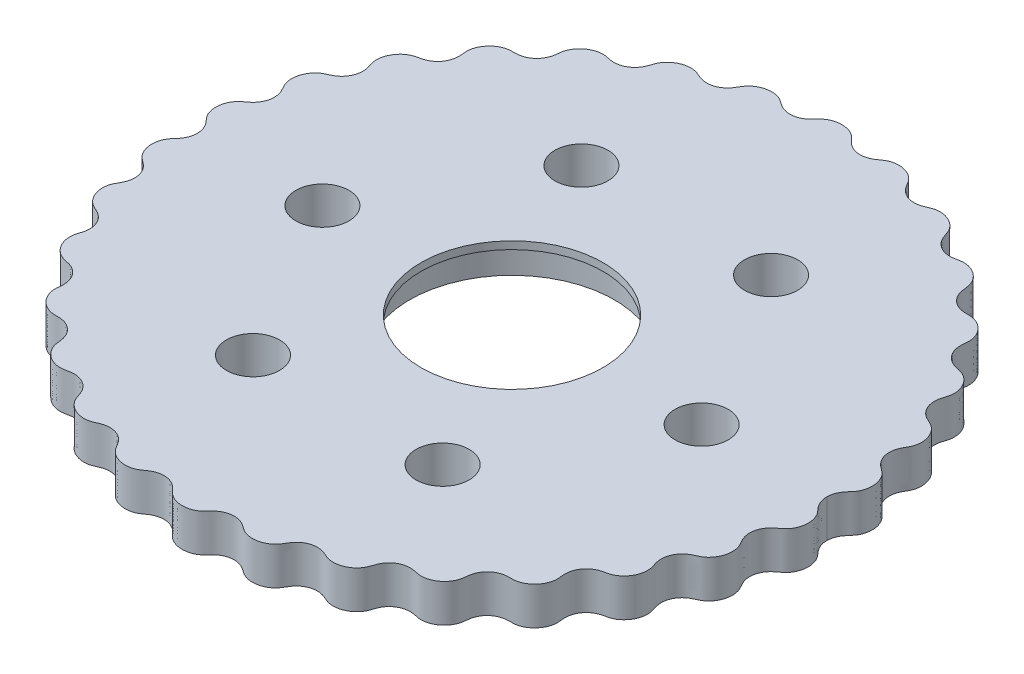
from build123d import *

# Parameters (mm, degrees)
SKETCH1_R           = 13.5
SKETCH1_R_2         = 3.5
BOSS_EXTRUDE1_DEPTH = 5
BOSS_EXTRUDE2_START = -1
SKETCH2_R           = 13.5
SKETCH2_R_2         = 12
BOSS_EXTRUDE2_DEPTH = 1


with BuildPart() as part:
    # Sketch1 → Boss-Extrude1 (new body)
    with BuildSketch(Plane(origin=(0, 0, 0), x_dir=(1, 0, 0), z_dir=(0, 1, 0))):
        with BuildLine():
            add(Edge.make_bspline(
                [(-40.502879456, 0.072075967), (-40.504437979, 0.130996079), (-40.51138778, 0.248395874), (-40.532676958, 0.420060144), (-40.563595901, 0.584575225), (-40.602489077, 0.739823779), (-40.647493865, 0.884373714), (-40.696740736, 1.017464677), (-40.748507566, 1.138919757), (-40.801315678, 1.24901788), (-40.853971517, 1.348358237), (-40.905566865, 1.437737911), (-40.955452736, 1.518053147), (-41.003200154, 1.590226623), (-41.048557281, 1.655158264), (-41.091408772, 1.713695013), (-41.131740315, 1.766614676), (-41.169609386, 1.814619504), (-41.205122093, 1.858336083), (-41.238415444, 1.898319005), (-41.269644122, 1.935056574), (-41.298970883, 1.968977383), (-41.326559757, 2.000457049), (-41.352571378, 2.029824666), (-41.385356076, 2.066550126), (-41.423147749, 2.108542416), (-41.464448335, 2.15435335), (-41.502588583, 2.19688879), (-41.538304261, 2.237181587), (-41.572193873, 2.276058726), (-41.604736385, 2.314190498), (-41.636308372, 2.352126091), (-41.66719947, 2.390319698), (-41.702696921, 2.435621407), (-41.74275206, 2.488987583), (-41.787433101, 2.552040674), (-41.831832015, 2.618765507), (-41.87589404, 2.689657448), (-41.924284254, 2.773454615), (-41.97641295, 2.872431769), (-42.031118653, 2.989178088), (-42.082743569, 3.114690211), (-42.130316107, 3.248712123), (-42.172861536, 3.390760817), (-42.209446628, 3.540153734), (-42.239215184, 3.696033586), (-42.261417612, 3.857394081), (-42.27543466, 4.02310605), (-42.280795973, 4.191944392), (-42.277193708, 4.362615661), (-42.264491401, 4.533786152), (-42.242728201, 4.704110186), (-42.21211854, 4.872258299), (-42.173047296, 5.036944979), (-42.126060473, 5.196955609), (-42.071851388, 5.351172298), (-42.011242336, 5.498598285), (-41.945161595, 5.638380692), (-41.874615525, 5.769831482), (-41.800655342, 5.892446603), (-41.724337781, 6.005923513), (-41.65315005, 6.101489757), (-41.588123412, 6.181754491), (-41.529684961, 6.24905118), (-41.471588, 6.311646259), (-41.413991663, 6.36987325), (-41.356929905, 6.424166958), (-41.306569421, 6.469421444), (-41.262545242, 6.507274988), (-41.224668547, 6.538773169), (-41.18642129, 6.569609232), (-41.147497937, 6.600118511), (-41.107502522, 6.630697696), (-41.065930675, 6.661821977), (-41.022148437, 6.694068788), (-40.975367408, 6.728151191), (-40.933075132, 6.758829314), (-40.896662403, 6.785314335), (-40.867890994, 6.806326942), (-40.837472278, 6.828687952), (-40.80520515, 6.8526265), (-40.770873157, 6.878406434), (-40.734245601, 6.906332265), (-40.695079807, 6.936755941), (-40.653125022, 6.970084426), (-40.608128617, 7.0067879), (-40.559845386, 7.047408235), (-40.508050966, 7.092567068), (-40.45256056, 7.142972336), (-40.393254201, 7.199421457), (-40.330109679, 7.2627985), (-40.263243664, 7.334061571), (-40.192960398, 7.414215591), (-40.119805106, 7.504264806), (-40.044615968, 7.605139616), (-39.968564176, 7.71759443), (-39.893167081, 7.842078482), (-39.82025686, 7.978590483), (-39.75188923, 8.126539641), (-39.690186586, 8.284646601), (-39.637127827, 8.45092184), (-39.594318767, 8.622749866), (-39.562792836, 8.797083135), (-39.542891576, 8.970716981), (-39.534254661, 9.140589965), (-39.535917045, 9.304046435), (-39.546481184, 9.459013321), (-39.564317593, 9.604072511), (-39.587750551, 9.738439325), (-39.61520126, 9.861875733), (-39.64527891, 9.974571352), (-39.676823931, 10.077019673), (-39.708914841, 10.16990725), (-39.74085163, 10.254024228), (-39.772126761, 10.330197813), (-39.80239185, 10.399246398), (-39.831425054, 10.461950381), (-39.859101884, 10.519035516), (-39.885370522, 10.571165089), (-39.910231773, 10.618937972), (-39.933723271, 10.662890366), (-39.955907315, 10.70349966), (-39.976861708, 10.741189367), (-39.996672974, 10.776334444), (-40.021684239, 10.820243954), (-40.050544348, 10.870344333), (-40.082024465, 10.9247734), (-40.11097075, 10.975048666), (-40.13790876, 11.0223924), (-40.16327161, 11.067783475), (-40.187406205, 11.11201258), (-40.210582348, 11.155723144), (-40.233002449, 11.19944198), (-40.258445601, 11.250962314), (-40.286665335, 11.311178152), (-40.317406246, 11.381676129), (-40.347121638, 11.455622576), (-40.37567026, 11.533516358), (-40.40583505, 11.624824094), (-40.436594468, 11.731658585), (-40.466307965, 11.856338966), (-40.491284938, 11.988987768), (-40.510625995, 12.129179167), (-40.523471245, 12.276260633), (-40.529039188, 12.429389439), (-40.526657039, 12.587564484), (-40.515784978, 12.7496577), (-40.496034529, 12.914444588), (-40.467181677, 13.080634469), (-40.429174977, 13.246900346), (-40.382138906, 13.411908286), (-40.326372615, 13.574346064), (-40.262344227, 13.7329508), (-40.190680815, 13.886535246), (-40.112154132, 14.034012415), (-40.027662196, 14.174418207), (-39.938206731, 14.306931737), (-39.844866412, 14.430893111), (-39.748765726, 14.545818429), (-39.651039046, 14.651411928), (-39.552789185, 14.747575245), (-39.463185027, 14.827177479), (-39.382735241, 14.89297488), (-39.311404335, 14.947340166), (-39.241362142, 14.997130926), (-39.17271331, 15.04269605), (-39.105423926, 15.084456847), (-39.046632456, 15.118640298), (-38.995648976, 15.14679194), (-38.952059849, 15.16991814), (-38.908315041, 15.192266129), (-38.864065863, 15.214092621), (-38.81886645, 15.235693295), (-38.772153561, 15.257414801), (-38.723222038, 15.279672085), (-38.671194832, 15.302973689), (-38.62435504, 15.32379454), (-38.584122423, 15.341708303), (-38.552370637, 15.355901573), (-38.518827736, 15.370999547), (-38.483258925, 15.387172682), (-38.445407455, 15.404619851), (-38.404994167, 15.423573956), (-38.361717819, 15.444308554), (-38.31525663, 15.467145584), (-38.265271617, 15.492464209), (-38.211412491, 15.520710676), (-38.153327146, 15.552408878), (-38.090676008, 15.588170956), (-38.023152759, 15.628706743), (-37.950513098, 15.674830091), (-37.872613047, 15.727459061), (-37.789457707, 15.787605691), (-37.701259868, 15.856349743), (-37.608505202, 15.934789895), (-37.512016686, 16.023966187), (-37.413005607, 16.124750195), (-37.31309134, 16.237705808), (-37.214269488, 16.362933874), (-37.118811563, 16.499926922), (-37.029091964, 16.647471009), (-36.947359051, 16.8036333), (-36.87549013, 16.965860538), (-36.814784203, 17.131185371), (-36.765841667, 17.296504474), (-36.728556118, 17.458869661), (-36.702210267, 17.61573184), (-36.685641072, 17.765097285), (-36.677428642, 17.905585137), (-36.676069641, 18.036400662), (-36.680111505, 18.157252639), (-36.688240065, 18.268244742), (-36.699324874, 18.369764488), (-36.712432204, 18.462384398), (-36.726816762, 18.546782031), (-36.741901519, 18.623679955), (-36.757252545, 18.693803598), (-36.772553286, 18.757853637), (-36.787580768, 18.816489388), (-36.802184904, 18.870320105), (-36.816271201, 18.919901655), (-36.829786743, 18.965736692), (-36.84270907, 19.008276968), (-36.855037497, 19.047926813), (-36.866786445, 19.085047178), (-36.881711691, 19.131597379), (-36.899056905, 19.184994051), (-36.918052029, 19.243343483), (-36.935508568, 19.297498426), (-36.951676302, 19.348685212), (-36.966762914, 19.397889825), (-36.980930586, 19.445909195), (-36.99429738, 19.49339003), (-37.009048067, 19.548769885), (-37.024772089, 19.612760421), (-37.040945676, 19.686817628), (-37.055488537, 19.76374034), (-37.068194011, 19.84408625), (-37.078787955, 19.928216235), (-37.087858358, 20.026121024), (-37.093877293, 20.139595162), (-37.094663409, 20.270442037), (-37.088843047, 20.407890765), (-37.075654486, 20.551249677), (-37.054434438, 20.699630613), (-37.024645622, 20.851990842), (-36.985897403, 21.00716946), (-36.937960777, 21.163922366), (-36.880777963, 21.320955369), (-36.814467037, 21.47695596), (-36.739321852, 21.630623652), (-36.655807486, 21.78069879), (-36.564551425, 21.925989597), (-36.46633068, 22.065397193), (-36.362055013, 22.197938281), (-36.252746427, 22.322765205), (-36.139515044, 22.439183077), (-36.023531428, 22.546663683), (-35.905995298, 22.644855923), (-35.788100413, 22.733592552), (-35.670995147, 22.812893053), (-35.555737844, 22.882962529), (-35.452619784, 22.939084609), (-35.361410501, 22.984062492), (-35.281473608, 23.020178645), (-35.203780905, 23.052271422), (-35.128287816, 23.080726218), (-35.054780695, 23.105969116), (-34.990826933, 23.125966354), (-34.935421709, 23.142013837), (-34.888014781, 23.154938029), (-34.840317935, 23.167206648), (-34.791857793, 23.179011771), (-34.742041097, 23.190568936), (-34.690128146, 23.202127905), (-34.635199917, 23.213989457), (-34.585964272, 23.224441119), (-34.533246308, 23.235630641), (-34.487874818, 23.245326321), (-34.438340728, 23.256168388), (-34.398824533, 23.265006323), (-34.356634144, 23.274707098), (-34.311431312, 23.285459313), (-34.262847534, 23.297490986), (-34.210484727, 23.311078237), (-34.153917819, 23.32655549), (-34.092700213, 23.344327173), (-34.026373332, 23.364880681), (-33.954481847, 23.388799984), (-33.876596495, 23.416778654), (-33.792346589, 23.449630187), (-33.701464229, 23.488292251), (-33.603841431, 23.533819971), (-33.499599605, 23.587361779), (-33.38916746, 23.650110276), (-33.273358391, 23.723221025), (-33.153432114, 23.807695581), (-33.031119446, 23.904232676), (-32.90858704, 24.013063537), (-32.788324482, 24.133801291), (-32.672952167, 24.265344535), (-32.564972525, 24.405873705), (-32.46651081, 24.552961062), (-32.379102691, 24.703784071), (-32.303576077, 24.855400118), (-32.240046745, 25.005022859), (-32.18801423, 25.150244995), (-32.14652091, 25.289174744), (-32.11433062, 25.420481263), (-32.090091421, 25.543365979), (-32.072462274, 25.657486684), (-32.060197909, 25.762860744), (-32.052196012, 25.859767325), (-32.047515445, 25.948660623), (-32.045374916, 26.030099372), (-32.045140168, 26.104693376), (-32.046305634, 26.173065302), (-32.048474506, 26.235824942), (-32.051339533, 26.293553042), (-32.05466578, 26.346792088), (-32.058275778, 26.396041965), (-32.062037143, 26.441758863), (-32.065852456, 26.484356259), (-32.069651119, 26.524207128), (-32.074626822, 26.574126729), (-32.080588401, 26.631262298), (-32.087171894, 26.69345454), (-32.093128219, 26.750910492), (-32.098441916, 26.804943057), (-32.103110744, 26.856608749), (-32.107129554, 26.906759899), (-32.110482328, 26.956085119), (-32.113138802, 27.005140759), (-32.115372932, 27.062581086), (-32.116592463, 27.129130619), (-32.115913294, 27.206136988), (-32.112881788, 27.285896728), (-32.107164998, 27.368799849), (-32.097440053, 27.464634978), (-32.081908404, 27.57491105), (-32.058122619, 27.701068616), (-32.026747507, 27.832559609), (-31.987138147, 27.9686227), (-31.938778629, 28.108307062), (-31.881302552, 28.250521331), (-31.814507602, 28.394074888), (-31.738364785, 28.53771632), (-31.653022645, 28.680168706), (-31.558806806, 28.82016252), (-31.456215107, 28.956466138), (-31.345908588, 29.087913965), (-31.228698586, 29.21343202), (-31.105530185, 29.332060775), (-30.977462256, 29.442975002), (-30.845644322, 29.545500363), (-30.711290441, 29.639126479), (-30.575650239, 29.723516212), (-30.439977163, 29.798510886), (-30.305493831, 29.864131204), (-30.173354175, 29.920573575), (-30.044601673, 29.96820158), (-29.93049571, 30.004254692), (-29.830368081, 30.031455673), (-29.743213389, 30.051953784), (-29.659097417, 30.068811273), (-29.577968142, 30.082390022), (-29.499616212, 30.093061316), (-29.432079407, 30.100292169), (-29.374098921, 30.105208262), (-29.32489288, 30.108556245), (-29.275838193, 30.111135718), (-29.226506122, 30.113039098), (-29.176362061, 30.11435498), (-29.124741856, 30.115171028), (-29.070821899, 30.115580071), (-29.013580903, 30.115691409), (-28.962056286, 30.11565741), (-28.9177505, 30.11566371), (-28.882742511, 30.115724412), (-28.845697531, 30.115889609), (-28.806328057, 30.116221355), (-28.764314638, 30.116799274), (-28.719303194, 30.117725637), (-28.670902687, 30.11913172), (-28.618683493, 30.12118569), (-28.562177042, 30.12410226), (-28.500877499, 30.128154356), (-28.434246583, 30.13368687), (-28.361723013, 30.141132408), (-28.282738518, 30.151028472), (-28.196742744, 30.164034868), (-28.103239719, 30.180949043), (-28.001838361, 30.202715608), (-27.89231861, 30.230424446), (-27.774712498, 30.265289906), (-27.649395319, 30.308602331), (-27.517175968, 30.361643823), (-27.379368106, 30.425564341), (-27.237817521, 30.501223359), (-27.094859966, 30.589015987), (-26.953192158, 30.688717324), (-26.815658514, 30.79938762), (-26.684983082, 30.919375899), (-26.563499243, 31.046437746), (-26.452936421, 31.177950197), (-26.354307782, 31.311177419), (-26.267912001, 31.443528675), (-26.193430257, 31.572759498), (-26.130079998, 31.697090642), (-26.076784152, 31.815244964), (-26.032324183, 31.92642003), (-25.995459846, 32.030221028), (-25.965011293, 32.126576726), (-25.939907438, 32.215655074), (-25.919208192, 32.297788233), (-25.902108674, 32.373411274), (-25.887932336, 32.443015115), (-25.876118201, 32.507112266), (-25.866205729, 32.566213131), (-25.857819516, 32.62081051), (-25.85065501, 32.671370165), (-25.844465847, 32.718325723), (-25.839052969, 32.762076561), (-25.834255479, 32.802987649), (-25.829943088, 32.841390661), (-25.824698893, 32.889650841), (-25.81887062, 32.945143965), (-25.812518079, 33.005865414), (-25.806447371, 33.062210808), (-25.800392371, 33.115386264), (-25.794144472, 33.166364244), (-25.787529296, 33.215928413), (-25.780392587, 33.264709189), (-25.771291557, 33.321295661), (-25.759556608, 33.386179732), (-25.744111284, 33.46048029), (-25.725993661, 33.536757091), (-25.704788752, 33.61542629), (-25.68010019, 33.69669868), (-25.648384615, 33.789946229), (-25.607512081, 33.896179583), (-25.554753878, 34.016147161), (-25.493260241, 34.139432768), (-25.422621587, 34.265089757), (-25.342598504, 34.392033571), (-25.253129747, 34.519091045), (-25.154336157, 34.645041905), (-25.046519982, 34.768656704), (-24.930160066, 34.888730857), (-24.805903031, 35.004115459), (-24.674550759, 35.113744869), (-24.537044413, 35.21666108), (-24.394445294, 35.312034736), (-24.247912812, 35.399182641), (-24.098679856, 35.477581546), (-23.948025836, 35.546878004), (-23.797247617, 35.606894082), (-23.647628526, 35.657628667), (-23.500405459, 35.699254133), (-23.356734004, 35.732108067), (-23.217651165, 35.756679684), (-23.084034924, 35.77359048), (-22.967182153, 35.782736971), (-22.865731269, 35.786581157), (-22.778166112, 35.786943529), (-22.694282554, 35.784557019), (-22.613876823, 35.779754633), (-22.536572782, 35.77283707), (-22.470091637, 35.765029784), (-22.412990508, 35.757102642), (-22.364438104, 35.749583991), (-22.315859579, 35.741348234), (-22.266737819, 35.732376703), (-22.21643514, 35.722623294), (-22.164164184, 35.712013628), (-22.108950466, 35.700447247), (-22.059478101, 35.689912215), (-22.017064467, 35.680886981), (-21.983609271, 35.673807348), (-21.948259024, 35.666408445), (-21.910733806, 35.658687677), (-21.87072038, 35.650651403), (-21.827868552, 35.642318846), (-21.781787502, 35.63372722), (-21.732042345, 35.624938329), (-21.678151317, 35.616047024), (-21.619584187, 35.607191862), (-21.555762803, 35.598568344), (-21.486065033, 35.590444995), (-21.409833886, 35.583182325), (-21.326394092, 35.577254267), (-21.235079034, 35.573270885), (-21.13527121, 35.571999905), (-21.026459305, 35.574382881), (-20.908313741, 35.581539531), (-20.78077976, 35.594751524), (-20.644181993, 35.615415507), (-20.499327106, 35.644956097), (-20.347582681, 35.68469477), (-20.190904118, 35.735681404), (-20.031781918, 35.798510679), (-19.873093758, 35.873160916), (-19.717869586, 35.95889993), (-19.569006884, 36.054293686), (-19.42899418, 36.157327935), (-19.299702175, 36.265619756), (-19.182281208, 36.376670174), (-19.077171073, 36.488102256), (-18.984199661, 36.597842054), (-18.902731521, 36.704223332), (-18.831827852, 36.806019518), (-18.77039009, 36.902420348), (-18.717272736, 36.992975034), (-18.671362221, 37.077521273), (-18.631625506, 37.156113875), (-18.597135068, 37.228961009), (-18.567077276, 37.296371563), (-18.540750168, 37.358714152), (-18.517555159, 37.416386691), (-18.496985874, 37.469794773), (-18.478616099, 37.519336987), (-18.462088074, 37.565395465), (-18.447101765, 37.608330236), (-18.433405373, 37.648476287), (-18.420787156, 37.686142457), (-18.405162274, 37.733434604), (-18.387494099, 37.787710608), (-18.368312778, 37.846887905), (-18.350447614, 37.901562815), (-18.333358808, 37.952913305), (-18.316620325, 38.001891191), (-18.299884796, 38.049262819), (-18.282860358, 38.095642374), (-18.265295159, 38.141518891), (-18.243912368, 38.194904513), (-18.217869833, 38.256226044), (-18.185805973, 38.326354603), (-18.150453409, 38.398054532), (-18.111351787, 38.471538809), (-18.063294173, 38.555213537), (-18.004020678, 38.649717988), (-17.930709015, 38.755360623), (-17.848283582, 38.862762043), (-17.756470731, 38.970959972), (-17.655191779, 39.078873182), (-17.544561724, 39.185354295), (-17.424885671, 39.289233247), (-17.296651519, 39.389356024), (-17.160519358, 39.484618485), (-17.01730758, 39.57399611), (-16.867975927, 39.656569771), (-16.713605743, 39.731547647), (-16.555377705, 39.798283231), (-16.39454735, 39.856289333), (-16.232418722, 39.905247975), (-16.07031644, 39.945015999), (-15.909556489, 39.975626249), (-15.751415959, 39.997284124), (-15.597101885, 40.010359287), (-15.447719195, 40.01537225), (-15.304237581, 40.012975444), (-15.167456757, 40.00392824), (-15.048759718, 39.990303709), (-14.946418649, 39.974310667), (-14.858635301, 39.957496846), (-14.775103464, 39.938606393), (-14.695622923, 39.917946925), (-14.619844875, 39.895769765), (-14.555308252, 39.874859286), (-14.500407658, 39.855726778), (-14.454131907, 39.838734451), (-14.40828342, 39.821097383), (-14.362427704, 39.802722987), (-14.316033909, 39.783471712), (-14.268451637, 39.763150052), (-14.218880633, 39.741503991), (-14.166330589, 39.718213925), (-14.1190283, 39.69711343), (-14.078301441, 39.678994219), (-14.046079291, 39.664725196), (-14.011920716, 39.649715756), (-13.975533663, 39.633905868), (-13.936589217, 39.617238926), (-13.894717055, 39.599665442), (-13.849500715, 39.581148086), (-13.800472935, 39.561668459), (-13.747111481, 39.541236069), (-13.688836125, 39.519900016), (-13.625007778, 39.497763954), (-13.554931258, 39.475004782), (-13.477863734, 39.451895342), (-13.393031601, 39.428830864), (-13.299659174, 39.406358023), (-13.197013064, 39.385203972), (-13.084465858, 39.366300601), (-12.961581251, 39.350796512), (-12.828219229, 39.340046487), (-12.684653682, 39.335566469), (-12.531686147, 39.33894346), (-12.370730026, 39.351696189), (-12.203833698, 39.375095234), (-12.033614043, 39.409968558), (-11.863088049, 39.456533872), (-11.695417831, 39.514303947), (-11.53361388, 39.582098004), (-11.380258627, 39.658163785), (-11.237307507, 39.740382179), (-11.105999463, 39.82650468), (-10.986875791, 39.914371982), (-10.879880067, 40.002077317), (-10.784500873, 40.088060556), (-10.699922146, 40.171138456), (-10.625157006, 40.250487348), (-10.559153252, 40.325597239), (-10.50086828, 40.396213613), (-10.449316895, 40.462278309), (-10.403597848, 40.523876146), (-10.362905161, 40.581190255), (-10.326529415, 40.634466693), (-10.293853019, 40.683987615), (-10.264342246, 40.730051688), (-10.237537949, 40.772960288), (-10.213046073, 40.813008171), (-10.190528661, 40.85047746), (-10.169695673, 40.885634038), (-10.15029775, 40.918725657), (-10.12606068, 40.960399742), (-10.098341271, 41.008434736), (-10.067987779, 41.06105565), (-10.039622164, 41.109859606), (-10.012521052, 41.155827737), (-9.986105849, 41.199753143), (-9.959904067, 41.242272127), (-9.933522574, 41.283890644), (-9.902146472, 41.331858903), (-9.864955838, 41.386359735), (-9.820506216, 41.447976698), (-9.772787287, 41.510324689), (-9.721254996, 41.573606972), (-9.665465278, 41.637848569), (-9.598351304, 41.710168436), (-9.517555367, 41.790615131), (-9.420282887, 41.87875072), (-9.313677779, 41.966334575), (-9.197757439, 42.052332837), (-9.072750484, 42.135656423), (-8.939083952, 42.21520907), (-8.797369937, 42.289926653), (-8.648389473, 42.35881141), (-8.493074215, 42.420960925), (-8.332485794, 42.475592562), (-8.167793092, 42.522063444), (-8.000247687, 42.55988608), (-7.831157772, 42.588739651), (-7.661860879, 42.608476909), (-7.493695753, 42.619126617), (-7.327973698, 42.620891455), (-7.165949707, 42.614141266), (-7.00879361, 42.599401498), (-6.857561397, 42.577336626), (-6.713166718, 42.548728235), (-6.576352353, 42.514447269), (-6.447661103, 42.475419689), (-6.337426374, 42.436153963), (-6.243395089, 42.39833631), (-6.163438243, 42.363005227), (-6.087952344, 42.326670857), (-6.016610394, 42.289551073), (-5.948940093, 42.251762912), (-5.891477053, 42.217563534), (-5.842594191, 42.187065456), (-5.801325325, 42.160413756), (-5.760298598, 42.133084475), (-5.719043803, 42.104846068), (-5.676990384, 42.075392168), (-5.633440714, 42.044328917), (-5.587534335, 42.011161708), (-5.546421936, 41.981262281), (-5.511138786, 41.955619872), (-5.483274273, 41.935422282), (-5.453779255, 41.914148512), (-5.422395189, 41.891681606), (-5.388828887, 41.86789944), (-5.352747536, 41.842676934), (-5.313773203, 41.815889393), (-5.271476975, 41.787417346), (-5.22537295, 41.757153397), (-5.174912516, 41.725011669), (-5.119479637, 41.690940558), (-5.058388245, 41.654939562), (-4.990883426, 41.617080927), (-4.916148753, 41.577536641), (-4.833322972, 41.536610736), (-4.741530071, 41.49477583), (-4.639927249, 41.452711031), (-4.527775032, 41.411335741), (-4.404531868, 41.371830555), (-4.269971146, 41.335633121), (-4.124311091, 41.304394948), (-3.968337932, 41.279887093), (-3.803492803, 41.263850779), (-3.631887958, 41.257804157), (-3.456224312, 41.262835459), (-3.279602901, 41.279427934), (-3.1052535, 41.307363577), (-2.936232177, 41.345735564), (-2.775151637, 41.393068409), (-2.623997098, 41.447513723), (-2.484051857, 41.507072155), (-2.355924874, 41.569794207), (-2.239650693, 41.633929124), (-2.134825078, 41.698011717), (-2.04074486, 41.760893368), (-1.956531445, 41.821731911), (-1.881228395, 41.879956649), (-1.813871652, 41.935222152), (-1.753535632, 41.987360335), (-1.69936027, 42.036336443), (-1.650564241, 42.082211549), (-1.606448848, 42.125112249), (-1.566396045, 42.165207146), (-1.529863105, 42.202689188), (-1.496375645, 42.237762792), (-1.465520086, 42.27063473), (-1.436936223, 42.301507886), (-1.41031027, 42.330577148), (-1.377054656, 42.367176769), (-1.339087322, 42.409313678), (-1.297710292, 42.455329066), (-1.25930143, 42.497823442), (-1.222902013, 42.537643019), (-1.187745826, 42.57547509), (-1.153211517, 42.611870841), (-1.118788565, 42.647266221), (-1.084052633, 42.682000148), (-1.042746817, 42.722051661), (-0.993920024, 42.767470732), (-0.935969006, 42.818496583), (-0.874351372, 42.869623674), (-0.808565341, 42.92085318), (-0.730418701, 42.977741336), (-0.637587269, 43.039944687), (-0.527371779, 43.106585866), (-0.408115863, 43.17109783), (-0.279968067, 43.232488558), (-0.14330277, 43.289738207), (0.001302446, 43.341846549), (0.15308776, 43.387871024), (0.31113358, 43.426958966), (0.474384022, 43.458374034), (0.641671746, 43.481517579), (0.811743945, 43.495945162), (0.983289336, 43.501378392), (1.154965836, 43.497712182), (1.325428628, 43.485017457), (1.493358252, 43.463539328), (1.657488389, 43.433690723), (1.816633005, 43.396041447), (1.969712556, 43.351302578), (2.115779054, 43.300306075), (2.254039838, 43.243979325), (2.38388012, 43.183314201), (2.504884531, 43.119329912), (2.607527179, 43.058553587), (2.69429118, 43.002290068), (2.767451141, 42.951213389), (2.835892896, 42.899978712), (2.89992877, 42.84878168), (2.959984527, 42.797704827), (3.010325194, 42.75235155), (3.052620996, 42.712532372), (3.087936, 42.678168037), (3.122618466, 42.643374772), (3.157031424, 42.607886691), (3.191607768, 42.571354942), (3.226868964, 42.533331726), (3.26345055, 42.493251816), (3.302137499, 42.45041142), (3.336950691, 42.411689591), (3.366975465, 42.37837244), (3.390773867, 42.35206281), (3.416067758, 42.324268815), (3.443103489, 42.29481534), (3.472163126, 42.263515538), (3.503570195, 42.23017248), (3.53769613, 42.194582), (3.574967358, 42.156537219), (3.615872793, 42.115835363), (3.66097132, 42.072287626), (3.710898518, 42.025733017), (3.766371423, 41.976057231), (3.828189444, 41.923217604), (3.897228746, 41.867275006), (3.974426377, 41.808432901), (4.060749458, 41.747082548), (4.157144144, 41.683851146), (4.264459485, 41.619646519), (4.383343735, 41.555687888), (4.514116039, 41.493508292), (4.656625326, 41.434912292), (4.810119563, 41.381875437), (4.973158751, 41.336382273), (5.143607973, 41.300217452), (5.318736557, 41.274745156), (5.495424447, 41.260726167), (5.670444435, 41.258219809), (5.84076316, 41.266596769), (6.003797725, 41.284656337), (6.157581544, 41.310812809), (6.300823314, 41.343302854), (6.432872236, 41.380370943), (6.553620134, 41.420406848), (6.663374543, 41.46202786), (6.762730368, 41.504112117), (6.852457325, 41.545795999), (6.933410811, 41.586449422), (7.006467002, 41.625640492), (7.072479254, 41.663097534), (7.132251392, 41.698673317), (7.186523417, 41.732313885), (7.235965783, 41.764032777), (7.281179234, 41.793890505), (7.322698002, 41.821978698), (7.360994823, 41.848408146), (7.39648677, 41.873299992), (7.429541262, 41.896779377), (7.460481856, 41.918970966), (7.499297562, 41.947004204), (7.543884457, 41.979421201), (7.592778095, 42.014965571), (7.638374341, 42.047871354), (7.681718832, 42.07873348), (7.723651789, 42.108034715), (7.76485517, 42.136158548), (7.805887234, 42.163402451), (7.854095042, 42.194421544), (7.910311687, 42.229051256), (7.976099184, 42.267234), (8.045197604, 42.304756185), (8.118179442, 42.341576616), (8.195454574, 42.377533336), (8.286390178, 42.416246791), (8.393157181, 42.456794379), (8.518123203, 42.497629703), (8.651380815, 42.534136603), (8.792486679, 42.565378132), (8.940782963, 42.59045407), (9.095428525, 42.608539371), (9.255427101, 42.61891445), (9.419655947, 42.620989713), (9.586894365, 42.614324433), (9.755852515, 42.598640512), (9.925200292, 42.573831351), (10.093596115, 42.539965996), (10.259715324, 42.497288705), (10.422277876, 42.446214018), (10.580075002, 42.387317417), (10.731994479, 42.321321624), (10.877044201, 42.249078561), (11.014373776, 42.171546918), (11.14329391, 42.089765208), (11.263293458, 42.004819996), (11.374054129, 41.917808773), (11.475463048, 41.829796535), (11.559943639, 41.749100523), (11.63024342, 41.676333232), (11.688729626, 41.611568796), (11.742737282, 41.547711467), (11.792657267, 41.48482187), (11.838972598, 41.422807886), (11.877460914, 41.368206323), (11.909648938, 41.32045636), (11.936471058, 41.279301454), (11.962815185, 41.237604434), (11.989019975, 41.194956465), (12.015486304, 41.150838313), (12.042696936, 41.104597653), (12.071244394, 41.055422127), (12.096766512, 41.01116006), (12.118702193, 40.973162242), (12.136060681, 40.943188792), (12.154492396, 40.911544355), (12.174189274, 40.87801467), (12.195373407, 40.842366634), (12.218302611, 40.804348371), (12.243276907, 40.763690177), (12.270645969, 40.720106743), (12.300817504, 40.673301222), (12.334266394, 40.622971894), (12.371544208, 40.568822386), (12.413288318, 40.510576635), (12.460229335, 40.447999954), (12.513194783, 40.380927667), (12.573105974, 40.309302513), (12.640963794, 40.233221372), (12.717817978, 40.15299028), (12.804713741, 40.069184068), (12.902610233, 39.982703004), (13.012268279, 39.89481389), (13.134111455, 39.807158473), (13.268074897, 39.721710184), (13.413468757, 39.640664565), (13.568893105, 39.566261649), (13.7322415, 39.500559308), (13.900815832, 39.445198363), (14.071546347, 39.401212473), (14.241278081, 39.36892929), (14.407063393, 39.347984186), (14.566400654, 39.337434763), (14.717380236, 39.335938496), (14.858729245, 39.341947111), (14.989772088, 39.353879054), (15.110337078, 39.370248099), (15.220639927, 39.38974276), (15.321167819, 39.411262615), (15.412578284, 39.433922845), (15.495618875, 39.457038728), (15.571068034, 39.480099782), (15.639694539, 39.502740399), (15.70223175, 39.524711202), (15.759362889, 39.545853375), (15.811714056, 39.566076853), (15.859852434, 39.585342495), (15.904287736, 39.603647896), (15.945475559, 39.621016347), (15.983821708, 39.637488397), (16.01968691, 39.653115494), (16.064626377, 39.672901882), (16.116122006, 39.695818201), (16.172347349, 39.720892178), (16.224510808, 39.743981836), (16.273816089, 39.765466301), (16.321230008, 39.785657744), (16.367534415, 39.804803162), (16.41336509, 39.823089732), (16.459241178, 39.840651455), (16.513311863, 39.8603968), (16.576474735, 39.881983578), (16.650295164, 39.904973594), (16.727528534, 39.926558262), (16.808626344, 39.946531189), (16.903345363, 39.966624676), (17.013665413, 39.985572223), (17.141686837, 40.00146602), (17.277088309, 40.011711421), (17.419323486, 40.015464038), (17.567629621, 40.011947057), (17.72106741, 40.000485129), (17.878555555, 39.980530413), (18.038904354, 39.951682694), (18.200847872, 39.913703821), (18.363075291, 39.866526971), (18.524261344, 39.810261023), (18.683095758, 39.745190258), (18.838311442, 39.6717696), (18.98871118, 39.59061554), (19.133192491, 39.502492926), (19.270770352, 39.408297719), (19.400597461, 39.309035844), (19.521981755, 39.205798157), (19.634400904, 39.099731502), (19.737513588, 38.99200566), (19.831167398, 38.883775768), (19.915403305, 38.776139436), (19.98420237, 38.678924895), (20.040365272, 38.592302286), (20.086242736, 38.515953541), (20.127759229, 38.441384111), (20.165281977, 38.368640287), (20.199235865, 38.2976175), (20.226676036, 38.235753296), (20.249045806, 38.18219379), (20.26727903, 38.136437777), (20.284772743, 38.090526203), (20.301752038, 38.044062736), (20.318472611, 37.996545638), (20.335231608, 37.947345264), (20.352383805, 37.895676449), (20.367368878, 37.849749742), (20.383222408, 37.800913268), (20.396767999, 37.759164675), (20.41160093, 37.713912218), (20.423505381, 37.677978397), (20.436346502, 37.639786928), (20.450309725, 37.599049271), (20.465615048, 37.555450756), (20.482524226, 37.508650686), (20.501349248, 37.458283791), (20.522462102, 37.403963684), (20.546305768, 37.345289244), (20.573406061, 37.281855097), (20.604383617, 37.213267689), (20.639964633, 37.139168691), (20.680988127, 37.059267637), (20.728406256, 36.973385449), (20.783272816, 36.881509669), (20.846713631, 36.783860342), (20.919871764, 36.680962183), (21.003821246, 36.573713827), (21.099446816, 36.463439058), (21.207294991, 36.351899751), (21.327413738, 36.241248937), (21.459211444, 36.13390876), (21.601374914, 36.032374311), (21.751883336, 35.938967918), (21.908136149, 35.855590742), (22.067181293, 35.783527641), (22.225998976, 35.723349789), (22.381779879, 35.674930839), (22.532142954, 35.637559639), (22.675261941, 35.610110189), (22.809898421, 35.591224643), (22.935360818, 35.579474813), (23.051417959, 35.573483592), (23.158194402, 35.572002458), (23.256067551, 35.573950728), (23.345578162, 35.578426358), (23.427358946, 35.584698297), (23.502081409, 35.592188663), (23.570418674, 35.60045065), (23.633021122, 35.609145948), (23.690501693, 35.618023785), (23.743428094, 35.626902592), (23.792319751, 35.635654562), (23.837647827, 35.644193019), (23.879837149, 35.652462278), (23.919269208, 35.660429635), (23.968624493, 35.670628943), (24.025055558, 35.682570965), (24.086426877, 35.695664506), (24.1430974, 35.707634542), (24.196385518, 35.718603116), (24.247350929, 35.728679211), (24.296848773, 35.737947826), (24.345571118, 35.746466098), (24.394078919, 35.754263127), (24.450951239, 35.762521569), (24.516965252, 35.770729801), (24.593551976, 35.778152719), (24.673109381, 35.783530764), (24.756065275, 35.786574755), (24.852286593, 35.787001006), (24.963465204, 35.783182683), (25.091296045, 35.772840475), (25.225235337, 35.755522672), (25.364597653, 35.730506518), (25.508494704, 35.697177203), (25.655881997, 35.655053493), (25.805598443, 35.603806663), (25.956403687, 35.5432738), (26.107012803, 35.473465789), (26.256129101, 35.394570383), (26.402475011, 35.306950642), (26.544821036, 35.21113899), (26.682012589, 35.107827134), (26.812994488, 34.997852063), (26.936832824, 34.882178341), (27.052733947, 34.7618769), (27.160060253, 34.638100491), (27.258342506, 34.512055913), (27.347288436, 34.38497304), (27.42678734, 34.25807053), (27.496910476, 34.132517863), (27.557907019, 34.009393004), (27.605838053, 33.899614324), (27.643481811, 33.802809467), (27.673082801, 33.718208433), (27.698736556, 33.636247505), (27.720807667, 33.556916336), (27.739686682, 33.480049938), (27.753995645, 33.413597088), (27.764989196, 33.356423844), (27.77349479, 33.307827592), (27.781215128, 33.259315637), (27.788286728, 33.210474914), (27.794853223, 33.160787451), (27.801070598, 33.109607323), (27.807116196, 33.056131812), (27.813203672, 32.999364897), (27.818540036, 32.948287015), (27.823156464, 32.904391738), (27.82685519, 32.869725441), (27.830864464, 32.833064465), (27.835274649, 32.794131565), (27.840196556, 32.752619733), (27.845766689, 32.708190045), (27.852153714, 32.660469947), (27.859566344, 32.609052392), (27.868262861, 32.553496346), (27.878562391, 32.493329475), (27.890857961, 32.428054072), (27.905631071, 32.357157674), (27.923467095, 32.280130184), (27.945070113, 32.196489709), (27.971274731, 32.105819475), (28.003051003, 32.007817977), (28.041496871, 31.902363468), (28.087810855, 31.789591554), (28.143236774, 31.669980583), (28.208973414, 31.544433605), (28.286046607, 31.414338776), (28.375150601, 31.281584521), (28.476479068, 31.148505519), (28.589580237, 31.017744683), (28.713278139, 30.892036234), (28.84569555, 30.773941143), (28.984391056, 30.665587764), (29.126589665, 30.568475334), (29.269457833, 30.483381278), (29.41036327, 30.410381823), (29.547071061, 30.348964026), (29.677852741, 30.298189014), (29.801511051, 30.256864831), (29.917340544, 30.22369824), (30.02505021, 30.19740986), (30.124671634, 30.176809904), (30.216469364, 30.160839745), (30.300862924, 30.148587793), (30.378364195, 30.139288261), (30.44953021, 30.132309947), (30.514929487, 30.12714016), (30.575119315, 30.123367218), (30.6306314, 30.120663503), (30.681963587, 30.118770128), (30.729575857, 30.11748365), (30.77388918, 30.116644862), (30.815286217, 30.116129549), (30.854113138, 30.115840971), (30.902871707, 30.11565808), (30.958887661, 30.115657099), (31.020136426, 30.115689786), (31.076951177, 30.115551655), (31.130569451, 30.115102347), (31.181988374, 30.1142352), (31.232012138, 30.112858386), (31.281289169, 30.110884364), (31.338516627, 30.107780854), (31.404247882, 30.102935963), (31.479706699, 30.095399594), (31.557395494, 30.085421437), (31.637777386, 30.072632484), (31.72110814, 30.056660519), (31.817073972, 30.034971502), (31.926906947, 30.005555923), (32.051643895, 29.965780565), (32.180609178, 29.917675539), (32.31290759, 29.860731757), (32.447488025, 29.794594652), (32.583191795, 29.719077377), (32.718793577, 29.634169136), (32.853039268, 29.540038576), (32.984680407, 29.437032627), (33.112505787, 29.32567105), (33.235370258, 29.206636934), (33.352220688, 29.080763429), (33.462118925, 28.949016964), (33.564261572, 28.812477232), (33.657996346, 28.672314188), (33.742834769, 28.529762319), (33.818460958, 28.386092386), (33.884736254, 28.242580775), (33.941699428, 28.100476487), (33.989562191, 27.960965634), (34.028699681, 27.825133015), (34.059635555, 27.693919953), (34.081072394, 27.57856383), (34.095603538, 27.477975055), (34.10520122, 27.390840494), (34.111671189, 27.307082299), (34.115366105, 27.226536656), (34.116624871, 27.148865857), (34.11585445, 27.081888594), (34.113974795, 27.024249347), (34.11160055, 26.97517204), (34.108514198, 26.926011429), (34.104751804, 26.876255511), (34.100334712, 26.825270468), (34.095271649, 26.772271915), (34.08956463, 26.716288236), (34.084278518, 26.666142501), (34.079750855, 26.623175459), (34.076216993, 26.589299742), (34.072562063, 26.553526084), (34.068811946, 26.515578159), (34.065004619, 26.475147693), (34.061194356, 26.431891242), (34.057457096, 26.385427069), (34.053897255, 26.335332375), (34.050656278, 26.281141292), (34.047923238, 26.222344288), (34.04594776, 26.158389865), (34.045055409, 26.088689824), (34.045665433, 26.012629824), (34.048310261, 25.92958744), (34.053655333, 25.838960409), (34.062516623, 25.740208009), (34.07587149, 25.63290821), (34.094856431, 25.516831973), (34.120743261, 25.392033118), (34.154884227, 25.258947195), (34.198617951, 25.118485624), (34.253133794, 24.97210354), (34.319303258, 24.821814166), (34.397502187, 24.67012405), (34.487461907, 24.519876067), (34.588192968, 24.374010945), (34.698014728, 24.235286006), (34.814697314, 24.106009206), (34.935689201, 23.987846068), (35.058378965, 23.881735259), (35.180334748, 23.787915512), (35.29947982, 23.706037711), (35.41418738, 23.635321847), (35.523300616, 23.574720283), (35.62609772, 23.523060393), (35.722225112, 23.479153594), (35.811618847, 23.441868927), (35.894428016, 23.410175987), (35.970947813, 23.383164576), (36.041565312, 23.360048469), (36.106717996, 23.340159462), (36.166863586, 23.322936198), (36.222459087, 23.307910871), (36.273946976, 23.294695679), (36.321746685, 23.282970104), (36.366249874, 23.272469531), (36.407818333, 23.262975394), (36.446783637, 23.254306812), (36.495669355, 23.243649207), (36.551719441, 23.231695738), (36.612782378, 23.218763252), (36.669177615, 23.206687258), (36.722143151, 23.195049822), (36.772678314, 23.183523963), (36.821588235, 23.171842478), (36.869519694, 23.159778066), (36.916989846, 23.147130522), (36.972312336, 23.131483297), (37.035995586, 23.112047114), (37.109048151, 23.087562575), (37.183997899, 23.059983234), (37.261109883, 23.028872507), (37.349286159, 22.989941273), (37.449403348, 22.941011296), (37.562070806, 22.879309117), (37.677456136, 22.80873578), (37.794634121, 22.72891516), (37.912539806, 22.639652461), (38.030021301, 22.540938541), (38.145883487, 22.432950972), (38.258927394, 22.316050893), (38.367985025, 22.190776079), (38.471950458, 22.057830292), (38.56980732, 21.918069195), (38.660652716, 21.772483052), (38.74371753, 21.622176517), (38.818382989, 21.468345813), (38.884193328, 21.312253586), (38.940864374, 21.155201761), (38.988287851, 20.99850264), (39.026531211, 20.843448478), (39.055832731, 20.69127965), (39.076591626, 20.543151404), (39.089352789, 20.400098968), (39.094785701, 20.26300044), (39.093750885, 20.14340837), (39.088629271, 20.039841987), (39.081151982, 19.95067864), (39.071156328, 19.86552891), (39.058969952, 19.784229422), (39.04488054, 19.706463851), (39.030866543, 19.640033786), (39.017607609, 19.583394862), (39.005571283, 19.53557514), (38.992850205, 19.488128109), (38.979399024, 19.440615453), (38.965135933, 19.392498901), (38.949938119, 19.343116672), (38.933638349, 19.291652968), (38.916023987, 19.237097884), (38.900038147, 19.188011988), (38.886324499, 19.145778387), (38.875541321, 19.112383341), (38.864226635, 19.077006422), (38.852350846, 19.039353517), (38.839891354, 18.999094519), (38.826836601, 18.955859206), (38.813191469, 18.909233055), (38.798984351, 18.858753285), (38.78427634, 18.803905566), (38.76917295, 18.744122095), (38.753838841, 18.678782059), (38.738515858, 18.607215973), (38.723544469, 18.528715894), (38.709388125, 18.44255419), (38.696659133, 18.348014066), (38.686143177, 18.244435416), (38.678817532, 18.13127918), (38.675855525, 18.008211745), (38.67860732, 17.875207324), (38.688545957, 17.732660041), (38.707169433, 17.581489115), (38.735856625, 17.423211748), (38.775687778, 17.259953338), (38.827257066, 17.094368559), (38.890518981, 16.929463596), (38.964713248, 16.768337277), (39.048398397, 16.613887326), (39.139594636, 16.468543609), (39.236004227, 16.33408376), (39.335257338, 16.211560226), (39.435131237, 16.101334636), (39.533707789, 16.003189906), (39.629457608, 15.91648066), (39.721258751, 15.840286802), (39.808368259, 15.773546938), (39.890366799, 15.715160983), (39.96709318, 15.664060898), (40.038580143, 15.619253904), (40.104997782, 15.579844642), (40.166607119, 15.545042646), (40.223724034, 15.514160469), (40.276692422, 15.486606446), (40.325865032, 15.461874853), (40.371590317, 15.439535232), (40.414203847, 15.419221946), (40.454023056, 15.400624523), (40.491344364, 15.383479061), (40.526441953, 15.36756075), (40.570609527, 15.347716385), (40.621472431, 15.32507857), (40.677155207, 15.300316914), (40.728789345, 15.277159967), (40.777434728, 15.254985229), (40.823947645, 15.233296152), (40.869016125, 15.211686435), (40.913189254, 15.189815823), (40.964186533, 15.163656408), (41.022271319, 15.132416603), (41.088175054, 15.094724669), (41.155138083, 15.053872156), (41.223424813, 15.009337053), (41.293110774, 14.960678392), (41.372014398, 14.901623557), (41.46043565, 14.82983391), (41.558238698, 14.74248352), (41.656487195, 14.645797704), (41.754153104, 14.539681743), (41.850130391, 14.424245323), (41.943284297, 14.299794862), (42.032491953, 14.166824391), (42.116678193, 14.026003156), (42.194846385, 13.878160481), (42.266104969, 13.724267845), (42.329689775, 13.565418412), (42.384982223, 13.40280429), (42.431523343, 13.237691802), (42.469023572, 13.071395113), (42.497368208, 12.90524853), (42.516618406, 12.740577811), (42.52700757, 12.578670747), (42.528932964, 12.42074728), (42.522942329, 12.267929245), (42.509715162, 12.121209752), (42.490038221, 11.981421923), (42.464774546, 11.849206394), (42.437320741, 11.735328876), (42.409594529, 11.637730417), (42.382856021, 11.554404929), (42.354645091, 11.475426919), (42.325214428, 11.400497588), (42.294732323, 11.329163783), (42.266749955, 11.268382841), (42.241552041, 11.216545968), (42.219384057, 11.172702272), (42.196522677, 11.129045542), (42.172789039, 11.085087623), (42.147940724, 11.040233645), (42.121661953, 10.993754433), (42.093554116, 10.944749967), (42.068199021, 10.900875294), (42.04646372, 10.863245682), (42.029354719, 10.833545172), (42.011352585, 10.802129905), (41.992368228, 10.768733025), (41.972310874, 10.733053029), (41.951090704, 10.694749069), (41.92862265, 10.653435867), (41.904831688, 10.608678403), (41.879660109, 10.55998663), (41.85307729, 10.50681071), (41.825092605, 10.448537519), (41.795772116, 10.384489563), (41.765259632, 10.313928022), (41.733802424, 10.236062245), (41.701781319, 10.15006884), (41.669743764, 10.055124199), (41.63843673, 9.950454641), (41.60883376, 9.835407939), (41.582147435, 9.709547858), (41.559815573, 9.572768865), (41.5434482, 9.425420732), (41.534724899, 9.268423061), (41.53524078, 9.103340467), (41.546314433, 8.932385313), (41.568789557, 8.758322156), (41.602875586, 8.584269165), (41.648072436, 8.413422177), (41.703205797, 8.248754429), (41.766567893, 8.092755529), (41.836128112, 7.947260589), (41.909762208, 7.813390927), (41.98545281, 7.691595889), (42.061432056, 7.581764042), (42.136258591, 7.483366139), (42.208837516, 7.395598393), (42.27839978, 7.317506222), (42.34445834, 7.248079888), (42.406755116, 7.186321569), (42.465208239, 7.131287843), (42.519864891, 7.082113205), (42.570861991, 7.038020124), (42.618395055, 6.998320252), (42.662694483, 6.962410305), (42.704008129, 6.929765054), (42.742588883, 6.899929086), (42.778686147, 6.872508344), (42.81254021, 6.847162039), (42.844378752, 6.823595246), (42.884426926, 6.794204663), (42.930481587, 6.760710579), (42.980737345, 6.724251064), (43.027141128, 6.690412775), (43.070642129, 6.658322889), (43.11201026, 6.627285466), (43.151863928, 6.596735854), (43.190694487, 6.566208604), (43.228887053, 6.535314568), (43.273046405, 6.498459484), (43.323319491, 6.454707641), (43.380113232, 6.40249295), (43.437387316, 6.346656607), (43.495199583, 6.286696714), (43.559934381, 6.215057384), (43.631498316, 6.129391591), (43.709308344, 6.026921061), (43.785964145, 5.915238472), (43.860465103, 5.794383473), (43.931758307, 5.664617718), (43.998788274, 5.526407316), (44.060537109, 5.380405991), (44.116059017, 5.227436134), (44.164509138, 5.068468253), (44.20516749, 4.904598543), (44.237458198, 4.737024791), (44.260964176, 4.5670208), (44.275437324, 4.395909639), (44.280804234, 4.225036032), (44.277167405, 4.055738232), (44.264801897, 3.889319723), (44.244147374, 3.72702108), (44.215795425, 3.569992262), (44.180471991, 3.41926554), (44.139014644, 3.275729177), (44.092344282, 3.140101771), (44.041430562, 3.01290693), (43.991765029, 2.904319169), (43.944910973, 2.812009988), (43.901781678, 2.733789704), (43.857995189, 2.66025117), (43.813780924, 2.591107191), (43.769268422, 2.525946393), (43.729433779, 2.471070861), (43.694265686, 2.424797212), (43.663796286, 2.386054423), (43.632841523, 2.347909411), (43.60117755, 2.309976019), (43.568505804, 2.271790585), (43.534439135, 2.232791911), (43.498486171, 2.192294285), (43.460034036, 2.149450553), (43.425281195, 2.110909671), (43.395398277, 2.0776992), (43.371815593, 2.051396913), (43.346923992, 2.023470964), (43.320575738, 1.993660648), (43.292615036, 1.961668915), (43.262880182, 1.927156877), (43.231206962, 1.889737724), (43.197433738, 1.848970191), (43.161408807, 1.804351805), (43.123000736, 1.755312432), (43.082112507, 1.701208903), (43.038700377, 1.641322004), (42.992798344, 1.57485774), (42.944548787, 1.500955588), (42.894239223, 1.418707372), (42.842343791, 1.327191269), (42.789565932, 1.225525872), (42.736875667, 1.112948597), (42.685531094, 0.988920097), (42.637070294, 0.853250822), (42.593258496, 0.706237044), (42.555978969, 0.548782726), (42.527066756, 0.382474227), (42.508102029, 0.209572887), (42.500199442, 0.032901784), (42.5, 0)],
                knots=[3141, 3141, 3141, 3141, 3142, 3143, 3144, 3145, 3146, 3147, 3148, 3149, 3150, 3151, 3152, 3153, 3154, 3155, 3156, 3157, 3158, 3159, 3160, 3161, 3162, 3163, 3164, 3166, 3168, 3170, 3172, 3174, 3176, 3178, 3180, 3182, 3185, 3188, 3191, 3194, 3197, 3201, 3205, 3209, 3213, 3217, 3221, 3225, 3229, 3233, 3237, 3241, 3245, 3249, 3253, 3257, 3261, 3265, 3269, 3273, 3277, 3281, 3285, 3289, 3292, 3295, 3298, 3301, 3304, 3307, 3309, 3311, 3313, 3315, 3317, 3319, 3321, 3323, 3325, 3326, 3327, 3328, 3329, 3330, 3331, 3332, 3333, 3334, 3335, 3336, 3337, 3338, 3339, 3340, 3341, 3342, 3343, 3344, 3345, 3346, 3347, 3348, 3349, 3350, 3351, 3352, 3353, 3354, 3355, 3356, 3357, 3358, 3359, 3360, 3361, 3362, 3363, 3364, 3365, 3366, 3367, 3368, 3369, 3370, 3371, 3372, 3373, 3375, 3377, 3379, 3381, 3383, 3385, 3387, 3389, 3391, 3394, 3397, 3400, 3403, 3406, 3410, 3414, 3418, 3422, 3426, 3430, 3434, 3438, 3442, 3446, 3450, 3454, 3458, 3462, 3466, 3470, 3474, 3478, 3482, 3486, 3490, 3494, 3498, 3501, 3504, 3507, 3510, 3513, 3516, 3518, 3520, 3522, 3524, 3526, 3528, 3530, 3532, 3534, 3535, 3536, 3537, 3538, 3539, 3540, 3541, 3542, 3543, 3544, 3545, 3546, 3547, 3548, 3549, 3550, 3551, 3552, 3553, 3554, 3555, 3556, 3557, 3558, 3559, 3560, 3561, 3562, 3563, 3564, 3565, 3566, 3567, 3568, 3569, 3570, 3571, 3572, 3573, 3574, 3575, 3576, 3577, 3578, 3579, 3580, 3581, 3582, 3583, 3585, 3587, 3589, 3591, 3593, 3595, 3597, 3599, 3602, 3605, 3608, 3611, 3614, 3617, 3621, 3625, 3629, 3633, 3637, 3641, 3645, 3649, 3653, 3657, 3661, 3665, 3669, 3673, 3677, 3681, 3685, 3689, 3693, 3697, 3701, 3705, 3709, 3712, 3715, 3718, 3721, 3724, 3727, 3729, 3731, 3733, 3735, 3737, 3739, 3741, 3743, 3744, 3746, 3747, 3748, 3749, 3750, 3751, 3752, 3753, 3754, 3755, 3756, 3757, 3758, 3759, 3760, 3761, 3762, 3763, 3764, 3765, 3766, 3767, 3768, 3769, 3770, 3771, 3772, 3773, 3774, 3775, 3776, 3777, 3778, 3779, 3780, 3781, 3782, 3783, 3784, 3785, 3786, 3787, 3788, 3789, 3790, 3791, 3792, 3794, 3796, 3798, 3800, 3802, 3804, 3806, 3808, 3810, 3813, 3816, 3819, 3822, 3825, 3829, 3833, 3837, 3841, 3845, 3849, 3853, 3857, 3861, 3865, 3869, 3873, 3877, 3881, 3885, 3889, 3893, 3897, 3901, 3905, 3909, 3913, 3917, 3920, 3923, 3926, 3929, 3932, 3935, 3937, 3939, 3941, 3943, 3945, 3947, 3949, 3951, 3953, 3954, 3955, 3956, 3957, 3958, 3959, 3960, 3961, 3962, 3963, 3964, 3965, 3966, 3967, 3968, 3969, 3970, 3971, 3972, 3973, 3974, 3975, 3976, 3977, 3978, 3979, 3980, 3981, 3982, 3983, 3984, 3985, 3986, 3987, 3988, 3989, 3990, 3991, 3992, 3993, 3994, 3995, 3996, 3997, 3998, 3999, 4000, 4001, 4002, 4004, 4006, 4008, 4010, 4012, 4014, 4016, 4018, 4021, 4024, 4027, 4030, 4033, 4036, 4040, 4044, 4048, 4052, 4056, 4060, 4064, 4068, 4072, 4076, 4080, 4084, 4088, 4092, 4096, 4100, 4104, 4108, 4112, 4116, 4120, 4124, 4128, 4131, 4134, 4137, 4140, 4143, 4146, 4148, 4150, 4152, 4154, 4156, 4158, 4160, 4162, 4163, 4164, 4165, 4166, 4167, 4168, 4169, 4170, 4171, 4172, 4173, 4174, 4175, 4176, 4177, 4178, 4179, 4180, 4181, 4182, 4183, 4184, 4185, 4186, 4187, 4188, 4189, 4190, 4191, 4192, 4193, 4194, 4195, 4196, 4197, 4198, 4199, 4200, 4201, 4202, 4203, 4204, 4205, 4206, 4207, 4208, 4209, 4210, 4211, 4213, 4215, 4217, 4219, 4221, 4223, 4225, 4227, 4229, 4232, 4235, 4238, 4241, 4244, 4248, 4252, 4256, 4260, 4264, 4268, 4272, 4276, 4280, 4284, 4288, 4292, 4296, 4300, 4304, 4308, 4312, 4316, 4320, 4324, 4328, 4332, 4336, 4339, 4342, 4345, 4348, 4351, 4354, 4356, 4358, 4360, 4362, 4364, 4366, 4368, 4370, 4372, 4373, 4374, 4375, 4376, 4377, 4378, 4379, 4380, 4381, 4382, 4383, 4384, 4385, 4386, 4387, 4388, 4389, 4390, 4391, 4392, 4393, 4394, 4395, 4396, 4397, 4398, 4399, 4400, 4401, 4402, 4403, 4404, 4405, 4406, 4407, 4408, 4409, 4410, 4411, 4412, 4413, 4414, 4415, 4416, 4417, 4418, 4419, 4420, 4421, 4423, 4425, 4427, 4429, 4431, 4433, 4435, 4437, 4440, 4443, 4446, 4449, 4452, 4455, 4459, 4463, 4467, 4471, 4475, 4479, 4483, 4487, 4491, 4495, 4499, 4503, 4507, 4511, 4515, 4519, 4523, 4527, 4531, 4535, 4539, 4543, 4547, 4550, 4553, 4556, 4559, 4562, 4565, 4567, 4569, 4571, 4573, 4575, 4577, 4579, 4581, 4582, 4583, 4584, 4585, 4586, 4587, 4588, 4589, 4590, 4591, 4592, 4593, 4594, 4595, 4596, 4597, 4598, 4599, 4600, 4601, 4602, 4603, 4604, 4605, 4606, 4607, 4608, 4609, 4610, 4611, 4612, 4613, 4614, 4615, 4616, 4617, 4618, 4619, 4620, 4621, 4622, 4623, 4624, 4625, 4626, 4627, 4628, 4629, 4630, 4632, 4634, 4636, 4638, 4640, 4642, 4644, 4646, 4648, 4651, 4654, 4657, 4660, 4663, 4667, 4671, 4675, 4679, 4683, 4687, 4691, 4695, 4699, 4703, 4707, 4711, 4715, 4719, 4723, 4727, 4731, 4735, 4739, 4743, 4747, 4751, 4755, 4758, 4761, 4764, 4767, 4770, 4773, 4775, 4777, 4779, 4781, 4783, 4785, 4787, 4789, 4791, 4792, 4793, 4794, 4795, 4796, 4797, 4798, 4799, 4800, 4801, 4802, 4803, 4804, 4805, 4806, 4807, 4808, 4809, 4810, 4811, 4812, 4813, 4814, 4815, 4816, 4817, 4818, 4819, 4820, 4821, 4822, 4823, 4824, 4825, 4826, 4827, 4828, 4829, 4830, 4831, 4832, 4833, 4834, 4835, 4836, 4837, 4838, 4839, 4840, 4842, 4844, 4846, 4848, 4850, 4852, 4854, 4856, 4859, 4862, 4865, 4868, 4871, 4874, 4878, 4882, 4886, 4890, 4894, 4898, 4902, 4906, 4910, 4914, 4918, 4922, 4926, 4930, 4934, 4938, 4942, 4946, 4950, 4954, 4958, 4962, 4966, 4969, 4972, 4975, 4978, 4981, 4984, 4986, 4988, 4990, 4992, 4994, 4996, 4998, 5000, 5001, 5002, 5003, 5004, 5005, 5006, 5007, 5008, 5009, 5010, 5011, 5012, 5013, 5014, 5015, 5016, 5017, 5018, 5019, 5020, 5021, 5022, 5023, 5024, 5025, 5026, 5027, 5028, 5029, 5030, 5031, 5032, 5033, 5034, 5035, 5036, 5037, 5038, 5039, 5040, 5041, 5042, 5043, 5044, 5045, 5046, 5047, 5048, 5049, 5051, 5053, 5055, 5057, 5059, 5061, 5063, 5065, 5067, 5070, 5073, 5076, 5079, 5082, 5086, 5090, 5094, 5098, 5102, 5106, 5110, 5114, 5118, 5122, 5126, 5130, 5134, 5138, 5142, 5146, 5150, 5154, 5158, 5162, 5166, 5170, 5174, 5177, 5180, 5183, 5186, 5189, 5192, 5194, 5196, 5198, 5200, 5202, 5204, 5206, 5208, 5209, 5211, 5212, 5213, 5214, 5215, 5216, 5217, 5218, 5219, 5220, 5221, 5222, 5223, 5224, 5225, 5226, 5227, 5228, 5229, 5230, 5231, 5232, 5233, 5234, 5235, 5236, 5237, 5238, 5239, 5240, 5241, 5242, 5243, 5244, 5245, 5246, 5247, 5248, 5249, 5250, 5251, 5252, 5253, 5254, 5255, 5256, 5257, 5258, 5260, 5262, 5264, 5266, 5268, 5270, 5272, 5274, 5276, 5279, 5282, 5285, 5288, 5291, 5295, 5299, 5303, 5307, 5311, 5315, 5319, 5323, 5327, 5331, 5335, 5339, 5343, 5347, 5351, 5355, 5359, 5363, 5367, 5371, 5375, 5379, 5383, 5386, 5389, 5392, 5395, 5398, 5401, 5403, 5405, 5407, 5409, 5411, 5413, 5415, 5417, 5419, 5420, 5421, 5422, 5423, 5424, 5425, 5426, 5427, 5428, 5429, 5430, 5431, 5432, 5433, 5434, 5435, 5436, 5437, 5438, 5439, 5440, 5441, 5442, 5443, 5444, 5445, 5446, 5447, 5448, 5449, 5450, 5451, 5452, 5453, 5454, 5455, 5456, 5457, 5458, 5459, 5460, 5461, 5462, 5463, 5464, 5465, 5466, 5467, 5468, 5470, 5472, 5474, 5476, 5478, 5480, 5482, 5484, 5487, 5490, 5493, 5496, 5499, 5502, 5506, 5510, 5514, 5518, 5522, 5526, 5530, 5534, 5538, 5542, 5546, 5550, 5554, 5558, 5562, 5566, 5570, 5574, 5578, 5582, 5586, 5590, 5594, 5597, 5600, 5603, 5606, 5609, 5612, 5614, 5616, 5618, 5620, 5622, 5624, 5626, 5628, 5629, 5630, 5631, 5632, 5633, 5634, 5635, 5636, 5637, 5638, 5639, 5640, 5641, 5642, 5643, 5644, 5645, 5646, 5647, 5648, 5649, 5650, 5651, 5652, 5653, 5654, 5655, 5656, 5657, 5658, 5659, 5660, 5661, 5662, 5663, 5664, 5665, 5666, 5667, 5668, 5669, 5670, 5671, 5672, 5673, 5674, 5675, 5676, 5677, 5679, 5681, 5683, 5685, 5687, 5689, 5691, 5693, 5695, 5698, 5701, 5704, 5707, 5710, 5714, 5718, 5722, 5726, 5730, 5734, 5738, 5742, 5746, 5750, 5754, 5758, 5762, 5766, 5770, 5774, 5778, 5782, 5786, 5790, 5794, 5798, 5802, 5805, 5808, 5811, 5814, 5817, 5820, 5822, 5824, 5826, 5828, 5830, 5832, 5834, 5836, 5838, 5839, 5840, 5841, 5842, 5843, 5844, 5845, 5846, 5847, 5848, 5849, 5850, 5851, 5852, 5853, 5854, 5855, 5856, 5857, 5858, 5859, 5860, 5861, 5862, 5863, 5864, 5865, 5866, 5867, 5868, 5869, 5870, 5871, 5872, 5873, 5874, 5875, 5876, 5877, 5878, 5879, 5880, 5881, 5882, 5883, 5884, 5885, 5886, 5887, 5889, 5891, 5893, 5895, 5897, 5899, 5901, 5903, 5906, 5909, 5912, 5915, 5918, 5921, 5925, 5929, 5933, 5937, 5941, 5945, 5949, 5953, 5957, 5961, 5965, 5969, 5973, 5977, 5981, 5985, 5989, 5993, 5997, 6001, 6005, 6009, 6013, 6016, 6019, 6022, 6025, 6028, 6031, 6033, 6035, 6037, 6039, 6041, 6043, 6045, 6047, 6048, 6049, 6050, 6051, 6052, 6053, 6054, 6055, 6056, 6057, 6058, 6059, 6060, 6061, 6062, 6063, 6064, 6065, 6066, 6067, 6068, 6069, 6070, 6071, 6072, 6073, 6074, 6075, 6076, 6077, 6078, 6079, 6080, 6081, 6082, 6083, 6084, 6085, 6086, 6087, 6088, 6089, 6090, 6091, 6092, 6093, 6094, 6095, 6096, 6098, 6100, 6102, 6104, 6106, 6108, 6110, 6112, 6114, 6117, 6120, 6123, 6126, 6129, 6133, 6137, 6141, 6145, 6149, 6153, 6157, 6161, 6165, 6169, 6173, 6177, 6181, 6185, 6189, 6193, 6197, 6201, 6205, 6209, 6213, 6217, 6221, 6224, 6227, 6230, 6233, 6236, 6239, 6241, 6243, 6245, 6247, 6249, 6251, 6253, 6255, 6257, 6258, 6259, 6260, 6261, 6262, 6263, 6264, 6265, 6266, 6267, 6268, 6269, 6270, 6271, 6272, 6273, 6274, 6275, 6276, 6277, 6278, 6279, 6280, 6281, 6282, 6282, 6282, 6282], degree=3))
            add(Edge.make_bspline(
                [(42.5, 0), (42.505778903, -0.177027645), (42.522760866, -0.350854408), (42.54993786, -0.518574249), (42.585800724, -0.677809871), (42.628545324, -0.826846326), (42.676283228, -0.964656836), (42.727217317, -1.0908408), (42.779761866, -1.205507972), (42.832605147, -1.309142949), (42.884724704, -1.402475585), (42.935370201, -1.486371964), (42.98402818, -1.561751177), (43.030379771, -1.629527027), (43.074258644, -1.690570678), (43.11561322, -1.745689338), (43.154474862, -1.795616339), (43.190932294, -1.841008814), (43.225111769, -1.882450075), (43.257162115, -1.920454664), (43.287243763, -1.95547468), (43.315520892, -1.987906519), (43.342155973, -2.018097475), (43.37568946, -2.055770065), (43.414271381, -2.098698803), (43.456319396, -2.145326515), (43.49503888, -2.188437551), (43.531195632, -2.229114177), (43.565414692, -2.268220783), (43.598197941, -2.306456324), (43.629941491, -2.344392268), (43.660951528, -2.382500406), (43.696542637, -2.427618776), (43.736660131, -2.480675375), (43.781383223, -2.543276562), (43.825820593, -2.60947045), (43.869936281, -2.679772742), (43.918418781, -2.76286872), (43.970705977, -2.861037116), (44.025672483, -2.976886002), (44.077655075, -3.101513094), (44.125685215, -3.234686914), (44.168786266, -3.375946244), (44.206019047, -3.524627727), (44.236518054, -3.679890694), (44.259521666, -3.840742848), (44.274396421, -4.006066312), (44.280656099, -4.174644503), (44.277975823, -4.345189656), (44.266201405, -4.516370874), (44.24535405, -4.686842404), (44.215630485, -4.855271852), (44.177398581, -5.020367981), (44.131188489, -5.180907753), (44.077679288, -5.335762285), (44.017681109, -5.483921408), (43.952112627, -5.624516604), (43.881973678, -5.756842145), (43.808312597, -5.880374415), (43.732187555, -5.994789587), (43.661084624, -6.091214241), (43.596071546, -6.172240039), (43.537604611, -6.240195634), (43.479449542, -6.303411653), (43.421780106, -6.362208627), (43.364649254, -6.417006842), (43.314252722, -6.462636634), (43.270236133, -6.500751989), (43.232404564, -6.532421494), (43.194254904, -6.563366967), (43.155498176, -6.593912848), (43.115758201, -6.624442109), (43.074554285, -6.655412284), (43.031280763, -6.687377638), (42.985182875, -6.721020308), (42.943638205, -6.751165202), (42.907953337, -6.777094626), (42.879798913, -6.797616685), (42.85007461, -6.819402552), (42.818585699, -6.842668738), (42.785121898, -6.86766428), (42.749458114, -6.894676353), (42.711356184, -6.924036712), (42.670568044, -6.956128949), (42.626840903, -6.991396475), (42.579925171, -7.030350942), (42.52958606, -7.073580586), (42.475620007, -7.121757567), (42.417877118, -7.175642781), (42.356290862, -7.236085871), (42.290915853, -7.304017123), (42.221973652, -7.380426841), (42.149904776, -7.466326813), (42.075422272, -7.562688182), (41.999558185, -7.670351237), (41.923689721, -7.789906528), (41.849528164, -7.921554074), (41.779053442, -8.064958287), (41.714383672, -8.219128101), (41.657583821, -8.382359524), (41.610438665, -8.552274572), (41.574234705, -8.725972069), (41.549603048, -8.900275083), (41.536463161, -9.072028655), (41.534078808, -9.238384868), (41.541204928, -9.397018647), (41.556282432, -9.54624288), (41.57763434, -9.6850224), (41.603628409, -9.812909752), (41.632789535, -9.929935535), (41.663861361, -10.036483847), (41.695826379, -10.133174703), (41.727897377, -10.22076536), (41.759492336, -10.300074553), (41.790202103, -10.371928637), (41.819757042, -10.437126116), (41.847996255, -10.496416372), (41.874840997, -10.550488647), (41.900272775, -10.59996801), (41.924315878, -10.645415815), (41.947023818, -10.687332855), (41.968469027, -10.726163957), (41.988735162, -10.762303209), (42.007911487, -10.7960993), (42.032147945, -10.838447777), (42.060171821, -10.886990264), (42.090840714, -10.940043969), (42.119141335, -10.989335303), (42.145571468, -11.036007749), (42.170537844, -11.080979382), (42.194363517, -11.124993511), (42.21729731, -11.168656205), (42.243227851, -11.219765789), (42.271901801, -11.279106422), (42.303108601, -11.348212473), (42.333315836, -11.420467833), (42.362435997, -11.496458878), (42.390274987, -11.576593871), (42.419482409, -11.670526859), (42.448934789, -11.780329941), (42.476871011, -11.908218469), (42.499710461, -12.043934913), (42.516564544, -12.186959246), (42.526600412, -12.33655906), (42.529076581, -12.491824821), (42.52337064, -12.651701161), (42.509001129, -12.81501798), (42.48564377, -12.980520822), (42.453142556, -13.146900993), (42.411515947, -13.31282525), (42.360958369, -13.476964919), (42.30183718, -13.638024179), (42.23468523, -13.794767201), (42.16018914, -13.94604381), (42.079173376, -14.090813361), (41.992580182, -14.228166476), (41.901445366, -14.357344393), (41.80686983, -14.477755653), (41.709986588, -14.588989974), (41.611922757, -14.690829233), (41.513755601, -14.783255647), (41.424569002, -14.859523978), (41.344717211, -14.92242469), (41.27405001, -14.974322446), (41.204742554, -15.021821907), (41.136829876, -15.065310098), (41.070189689, -15.10524905), (41.011797904, -15.138080268), (40.960940722, -15.165278779), (40.917252919, -15.1877656), (40.873139217, -15.209675736), (40.828174868, -15.231296164), (40.7818224, -15.25296194), (40.733407799, -15.275072357), (40.682091742, -15.298114342), (40.636044372, -15.318599613), (40.596592859, -15.336151581), (40.565508247, -15.350019589), (40.532722077, -15.364729899), (40.498008245, -15.380442791), (40.461119033, -15.397344939), (40.421784424, -15.415654643), (40.379712063, -15.43562803), (40.334588253, -15.457566326), (40.286080469, -15.481824248), (40.233842111, -15.508819471), (40.177520391, -15.539042961), (40.116768524, -15.573069671), (40.051263667, -15.611568644), (39.980732202, -15.65531091), (39.904984, -15.70517261), (39.82395688, -15.762129624), (39.737771421, -15.827238588), (39.646794091, -15.901598087), (39.551703201, -15.986283451), (39.453547254, -16.082250188), (39.353779857, -16.19020581), (39.254251313, -16.310458629), (39.15713763, -16.442764405), (39.064796427, -16.586204119), (38.979557204, -16.739132458), (38.903476829, -16.899229629), (38.838110223, -17.06366629), (38.784349882, -17.229358645), (38.742371072, -17.39326199), (38.711688334, -17.552640254), (38.69129773, -17.705261047), (38.679861461, -17.849492872), (38.675891433, -17.984309752), (38.677901182, -18.109227625), (38.684512489, -18.224203001), (38.694516923, -18.329520623), (38.706900655, -18.425688445), (38.72084358, -18.513349592), (38.735703006, -18.59321433), (38.75098986, -18.666010995), (38.766342795, -18.732452899), (38.781503405, -18.793217642), (38.796294193, -18.848935525), (38.810599891, -18.900184304), (38.824352144, -18.947488127), (38.837517261, -18.991319109), (38.850086595, -19.032100428), (38.86206911, -19.070210204), (38.877291231, -19.117910811), (38.894974572, -19.172464106), (38.914316785, -19.231844339), (38.932065214, -19.286745226), (38.948477136, -19.338449612), (38.963769311, -19.387987797), (38.97811318, -19.436191722), (38.991635548, -19.483736022), (39.004421851, -19.531169362), (39.018537019, -19.586899864), (39.033551907, -19.651761614), (39.048880618, -19.727257433), (39.062478603, -19.805941426), (39.074100566, -19.888262219), (39.084484334, -19.984072618), (39.09218252, -20.095221363), (39.095098678, -20.223623857), (39.091693636, -20.358817186), (39.081178836, -20.500188866), (39.062852788, -20.646914593), (39.03613123, -20.798001828), (39.000569927, -20.952327128), (38.955881652, -21.108671824), (38.901947601, -21.265755652), (38.838823751, -21.422269013), (38.766742405, -21.576903824), (38.686109186, -21.728382884), (38.597495704, -21.87548757), (38.501628079, -22.017083606), (38.399371515, -22.152144597), (38.29171109, -22.279773057), (38.179728898, -22.399218591), (38.064577616, -22.509892968), (37.947450505, -22.611381812), (37.829547682, -22.70345266), (37.712038285, -22.786059219), (37.596017805, -22.85934166), (37.491922503, -22.918266154), (37.399661673, -22.965634992), (37.318696482, -23.003758923), (37.239947641, -23.037693675), (37.163438041, -23.067804509), (37.089038276, -23.094498561), (37.024495522, -23.115587026), (36.968812249, -23.132431239), (36.921380062, -23.145922631), (36.873930436, -23.15863361), (36.826061686, -23.170743962), (36.777267458, -23.182451844), (36.726914086, -23.193981594), (36.674212505, -23.205595997), (36.618183082, -23.217615428), (36.567707281, -23.228308838), (36.524301586, -23.237543022), (36.490011748, -23.244896209), (36.453742938, -23.252778675), (36.415225979, -23.261311584), (36.374164038, -23.270640089), (36.330231081, -23.280938892), (36.28307093, -23.292418989), (36.232297365, -23.305335763), (36.177495835, -23.319998557), (36.118227623, -23.336781782), (36.054037555, -23.35613741), (35.9844667, -23.37860843), (35.909071852, -23.404842308), (35.827453827, -23.43560274), (35.739296704, -23.471776873), (35.644419628, -23.514373752), (35.542841499, -23.564508141), (35.434856207, -23.623362499), (35.321111693, -23.692119552), (35.202680261, -23.771859963), (35.081101181, -23.863425321), (34.958372542, -23.967257096), (34.836871311, -24.083235862), (34.719192237, -24.210557712), (34.60791776, -24.347688927), (34.505356342, -24.492428965), (34.413304225, -24.642085171), (34.332884633, -24.793729181), (34.264496874, -24.944480029), (34.207874889, -25.091754251), (34.162225882, -25.23343963), (34.126405973, -25.367976647), (34.099092782, -25.494357036), (34.078928228, -25.612063727), (34.064620371, -25.720979714), (34.055005042, -25.821288801), (34.049074706, -25.913383372), (34.045984011, -25.997786973), (34.045040816, -26.075094025), (34.045689518, -26.145925701), (34.047491401, -26.210899469), (34.050104943, -26.270609358), (34.053267685, -26.325614198), (34.056780378, -26.376431513), (34.060493621, -26.423535269), (34.064296836, -26.467356128), (34.06810937, -26.508283244), (34.071873378, -26.546666926), (34.076773156, -26.594873323), (34.08260251, -26.650275117), (34.089003485, -26.710909389), (34.09476998, -26.767226702), (34.09989273, -26.820457833), (34.104369864, -26.871593927), (34.108193587, -26.921435031), (34.11134386, -26.970627637), (34.114193, -27.027871566), (34.116187472, -27.093789724), (34.11650557, -27.169701133), (34.114617407, -27.24810773), (34.110203246, -27.329500426), (34.102919026, -27.414165861), (34.091243277, -27.512010366), (34.073301228, -27.624463675), (34.046578122, -27.752822238), (34.011995037, -27.886236559), (33.968955539, -28.02386428), (33.917001146, -28.164693151), (33.855829347, -28.307587547), (33.785306022, -28.451328217), (33.705472627, -28.594649505), (33.616548519, -28.736273627), (33.518928714, -28.874942622), (33.413177332, -29.009447925), (33.300017012, -29.1386575), (33.180314524, -29.261540365), (33.055062829, -29.37718826), (32.925359837, -29.484834241), (32.792384056, -29.583867891), (32.657367332, -29.673846918), (32.521564775, -29.754504849), (32.386221875, -29.825754573), (32.252538636, -29.887687456), (32.121630269, -29.940567774), (31.994483564, -29.984822149), (31.882122081, -30.018006881), (31.783722762, -30.042812525), (31.698179094, -30.061333856), (31.615664466, -30.076404813), (31.536047102, -30.088393592), (31.459019506, -30.097672519), (31.392384273, -30.1038374), (31.334890399, -30.107939773), (31.285836428, -30.110668115), (31.236600476, -30.112701917), (31.186671045, -30.114130381), (31.135412595, -30.115040995), (31.082036789, -30.115524829), (31.025566173, -30.115686558), (30.974917609, -30.115666251), (30.93148735, -30.115657393), (30.897233514, -30.115690086), (30.861051284, -30.115806074), (30.822665373, -30.116061464), (30.781769677, -30.116528171), (30.73802453, -30.117298552), (30.691054195, -30.118491211), (30.640444895, -30.120258225), (30.58574386, -30.122794057), (30.526460058, -30.12634638), (30.462067586, -30.131228974), (30.392013019, -30.137836706), (30.315728489, -30.146662221), (30.232652657, -30.15831347), (30.142262148, -30.173530249), (30.044116071, -30.193196655), (29.937915708, -30.218344645), (29.823579798, -30.250141952), (29.701332524, -30.289855949), (29.57179598, -30.338784799), (29.436071825, -30.398149713), (29.295789705, -30.46894921), (29.153096232, -30.55178829), (29.010562418, -30.646710486), (28.871002752, -30.753073044), (28.737224182, -30.869506944), (28.611749457, -30.993988282), (28.496573967, -31.124017813), (28.393008776, -31.256872801), (28.301636558, -31.389875038), (28.222373701, -31.520619738), (28.154606145, -31.647129312), (28.097356853, -31.767922282), (28.049448354, -31.882009256), (28.009637226, -31.988839015), (27.97671142, -32.088218978), (27.949551569, -32.180229393), (27.927162869, -32.265143748), (27.908685703, -32.343361666), (27.893392548, -32.415356128), (27.880677105, -32.481634252), (27.870039796, -32.542709585), (27.861072336, -32.599083536), (27.85344294, -32.651233707), (27.846882957, -32.699607213), (27.841175258, -32.744617493), (27.836144398, -32.786643458), (27.831648441, -32.826030154), (27.82621351, -32.875443748), (27.820229153, -32.932111561), (27.813779007, -32.99389699), (27.807674912, -33.051027331), (27.801635083, -33.104762679), (27.795441477, -33.156119103), (27.788914117, -33.205915572), (27.781895485, -33.254811214), (27.774241068, -33.303334844), (27.764409304, -33.360003857), (27.751663833, -33.42541267), (27.73485242, -33.500696656), (27.715146429, -33.578205801), (27.692140046, -33.658241971), (27.662483508, -33.750111575), (27.624097999, -33.854907944), (27.574286244, -33.973516468), (27.515921164, -34.095733853), (27.448536303, -34.220674274), (27.371831277, -34.347295451), (27.285681458, -34.474450506), (27.190143482, -34.60093118), (27.085456109, -34.725507205), (26.972036855, -34.846961566), (26.850474554, -34.964122459), (26.721518112, -35.075892001), (26.586061714, -35.181271744), (26.445126763, -35.279384887), (26.29984083, -35.369495042), (26.151413912, -35.451021355), (26.00111226, -35.523549766), (25.850230036, -35.58684021), (25.700058982, -35.640829499), (25.551856202, -35.685629649), (25.406810003, -35.721521388), (25.26600354, -35.74894248), (25.130375604, -35.768470473), (25.011485592, -35.779771876), (24.908099733, -35.78536525), (24.818779042, -35.787136921), (24.733184526, -35.785997146), (24.651182767, -35.782288271), (24.572482978, -35.776328299), (24.505032981, -35.769274984), (24.447369128, -35.761960775), (24.398579317, -35.754949346), (24.350066965, -35.74721862), (24.301386304, -35.738767973), (24.251987218, -35.729570837), (24.201190995, -35.719572702), (24.148159198, -35.708691053), (24.091853103, -35.696818825), (24.041126425, -35.685998411), (23.997451074, -35.676729372), (23.962904793, -35.669461232), (23.926301384, -35.661871391), (23.887341616, -35.653962146), (23.845690794, -35.645746937), (23.800975082, -35.637254943), (23.752777931, -35.628537044), (23.700636951, -35.619673476), (23.644041734, -35.610783548), (23.582433396, -35.60203779), (23.515206962, -35.593672851), (23.441718118, -35.586009307), (23.361296446, -35.579472183), (23.273267761, -35.574613349), (23.176988666, -35.572133934), (23.071896537, -35.572903318), (22.957577454, -35.577969216), (22.833852527, -35.588551021), (22.700878944, -35.606006606), (22.559255561, -35.631762531), (22.410114609, -35.667200824), (22.255173352, -35.713503999), (22.096716664, -35.771473874), (21.937488465, -35.841355991), (21.780489377, -35.922712935), (21.62870612, -36.014388127), (21.484824035, -36.114582327), (21.350984401, -36.221033341), (21.228635912, -36.331258726), (21.118500133, -36.442806055), (21.020638167, -36.553460863), (20.934583867, -36.661383147), (20.859503271, -36.765167413), (20.794347359, -36.863839266), (20.737978338, -36.956809629), (20.689262184, -37.043807521), (20.647128866, -37.124807557), (20.610606076, -37.199962457), (20.578833579, -37.269545677), (20.551064665, -37.333905736), (20.526659882, -37.393431682), (20.505076733, -37.448528103), (20.485857801, -37.499597844), (20.468618803, -37.547030609), (20.453037409, -37.591195916), (20.438843232, -37.632439174), (20.425809117, -37.671079916), (20.413743717, -37.707411489), (20.398732409, -37.753131741), (20.381635089, -37.805795979), (20.362908588, -37.863501083), (20.345323809, -37.91707911), (20.32837914, -37.967636366), (20.311674884, -38.016065812), (20.294882127, -38.063085533), (20.277722204, -38.109270073), (20.256991418, -38.162710049), (20.231923983, -38.223756703), (20.201226746, -38.293281279), (20.167478043, -38.364205176), (20.130188644, -38.436837991), (20.088930021, -38.511294686), (20.038265139, -38.596008514), (19.975897235, -38.691515029), (19.899001784, -38.797963684), (19.812860571, -38.905805386), (19.717277224, -39.01402426), (19.612250492, -39.121506918), (19.497971689, -39.22709205), (19.374819768, -39.329611625), (19.243352645, -39.42792767), (19.104295281, -39.520964408), (18.958524542, -39.607736408), (18.807051099, -39.687372823), (18.650998647, -39.759137754), (18.491580714, -39.822446677), (18.330075402, -39.876878827), (18.167798372, -39.922185404), (18.006074368, -39.958293439), (17.846207566, -39.985305159), (17.689450945, -40.003492641), (17.536974778, -40.013287515), (17.38983419, -40.01526541), (17.248935474, -40.010124689), (17.115000457, -39.998658861), (16.999067023, -39.983133138), (16.899279382, -39.965663384), (16.813769638, -39.947706175), (16.732422375, -39.927841335), (16.654961437, -39.906349356), (16.580947252, -39.883442043), (16.51765248, -39.861925033), (16.463509869, -39.842245427), (16.417606679, -39.824745711), (16.371792071, -39.806531187), (16.32555633, -39.787472344), (16.278275625, -39.767387234), (16.229183115, -39.74603465), (16.177331042, -39.72310862), (16.130838838, -39.702381484), (16.090932654, -39.684608429), (16.059423227, -39.670623556), (16.026086762, -39.655923062), (15.990644987, -39.640446332), (15.952784537, -39.624134982), (15.91215252, -39.606936101), (15.868351842, -39.588806696), (15.820936479, -39.569719711), (15.769407037, -39.54967204), (15.713207166, -39.528695047), (15.651721665, -39.506868129), (15.584277557, -39.484335836), (15.510149932, -39.461328934), (15.42857501, -39.4381894), (15.338773573, -39.415398632), (15.239988481, -39.393606929), (15.13154011, -39.373660439), (15.012902657, -39.356619224), (14.883801656, -39.343757286), (14.744327965, -39.336533052), (14.595055672, -39.336518635), (14.437141957, -39.345280379), (14.272378975, -39.364213388), (14.103166591, -39.394348739), (13.932385401, -39.436169264), (13.76317316, -39.489479988), (13.598638097, -39.553373882), (13.441566482, -39.626310483), (13.294186484, -39.706292069), (13.158032375, -39.791094342), (13.033921345, -39.878498252), (12.922024762, -39.966478826), (12.82199815, -40.053327758), (12.733132057, -40.137708112), (12.654494711, -40.21865408), (12.585049779, -40.295534537), (12.523743561, -40.367998182), (12.469563208, -40.435913737), (12.421571178, -40.499313697), (12.378922064, -40.558345938), (12.34086742, -40.613234578), (12.306753079, -40.664249813), (12.276012231, -40.711685543), (12.248156502, -40.755843392), (12.222766446, -40.797021705), (12.199482292, -40.835508303), (12.177995412, -40.871575996), (12.158040684, -40.905480066), (12.133172897, -40.94811614), (12.104845804, -40.997145393), (12.073982065, -41.050683405), (12.045275816, -41.100178478), (12.017968129, -41.146654244), (11.991454541, -41.190939412), (11.965243437, -41.233699923), (11.938927264, -41.27546636), (11.912162323, -41.316656806), (11.880069919, -41.364418835), (11.841728164, -41.419000179), (11.795617118, -41.480967713), (11.745934835, -41.543798703), (11.692191807, -41.607596739), (11.627525485, -41.679499433), (11.549590706, -41.759651888), (11.45556533, -41.847753948), (11.352253026, -41.935645315), (11.239594608, -42.022323953), (11.117745914, -42.106714091), (10.98706553, -42.187717264), (10.848102175, -42.264253838), (10.701579406, -42.335299155), (10.548378127, -42.399914234), (10.389516725, -42.457271795), (10.22612906, -42.506677781), (10.059440517, -42.547588521), (9.890742425, -42.579623542), (9.721365166, -42.602574017), (9.552650303, -42.616406787), (9.385922082, -42.62126387), (9.222458603, -42.617457361), (9.063462941, -42.605459587), (8.910034395, -42.585888326), (8.76313994, -42.55948681), (8.623585747, -42.527098101), (8.49198837, -42.489633174), (8.379015036, -42.451498495), (8.282505991, -42.414484338), (8.200375414, -42.379720845), (8.122824903, -42.343824956), (8.049588291, -42.30705218), (7.980264711, -42.269570683), (7.921623358, -42.235668403), (7.871992048, -42.2055061), (7.830315392, -42.179227398), (7.789162262, -42.152395133), (7.748121043, -42.124823718), (7.706694231, -42.096260764), (7.664276717, -42.066375314), (7.62012686, -42.034745055), (7.573327312, -42.000842992), (7.531164508, -41.970161537), (7.49480803, -41.943773191), (7.466006597, -41.922951569), (7.435425349, -41.900985171), (7.402785784, -41.877753763), (7.367771865, -41.853133139), (7.330024728, -41.826997957), (7.289136953, -41.799225916), (7.244646569, -41.769703724), (7.196031157, -41.738335404), (7.14270261, -41.705053608), (7.084003504, -41.669834691), (7.019206495, -41.632718319), (6.947518811, -41.593832241), (6.868094684, -41.55342249), (6.780059444, -41.511888421), (6.682549633, -41.469820557), (6.57477367, -41.428036924), (6.456096407, -41.387610495), (6.326147668, -41.349876894), (6.184948658, -41.316408791), (6.033040927, -41.288943519), (5.871592109, -41.269255766), (5.702444989, -41.258979649), (5.528077612, -41.259402584), (5.351456998, -41.271271289), (5.175796642, -41.294658417), (5.004259196, -41.328928902), (4.839665943, -41.372818538), (4.684273051, -41.424604351), (4.539651691, -41.482322129), (4.406676726, -41.543980708), (4.285601528, -41.607734376), (4.176183361, -41.671994995), (4.077824666, -41.735484264), (3.989704959, -41.797238345), (3.91088952, -41.856581163), (3.840410572, -41.913081378), (3.777322638, -41.966504286), (3.720736694, -42.016765747), (3.669838436, -42.063891864), (3.623895479, -42.107985748), (3.582257425, -42.149201329), (3.544351645, -42.187723441), (3.509676814, -42.22375312), (3.477795499, -42.257497076), (3.448326624, -42.28916038), (3.420938294, -42.31894156), (3.386808858, -42.356392127), (3.347982479, -42.399420926), (3.305861649, -42.446273151), (3.266933315, -42.48941045), (3.230192223, -42.529714247), (3.194837358, -42.567902313), (3.160220983, -42.604551784), (3.125812269, -42.640120516), (3.091170961, -42.674965842), (3.050054502, -42.715093094), (3.00153954, -42.760543073), (2.944040082, -42.811564135), (2.882952747, -42.862673991), (2.817757419, -42.913894785), (2.740316718, -42.970800539), (2.648305501, -43.03307563), (2.539009581, -43.099880599), (2.420671511, -43.164653829), (2.293415709, -43.226409008), (2.157594644, -43.284126764), (2.013766137, -43.336803032), (1.862672466, -43.3834878), (1.705218001, -43.423317952), (1.542445863, -43.455544237), (1.375513211, -43.479553152), (1.205665368, -43.494883933), (1.034208919, -43.501240871), (0.862484089, -43.49850103), (0.691836706, -43.486717419), (0.523590089, -43.466117624), (0.359017223, -43.437097908), (0.199313535, -43.400212733), (0.04557058, -43.356159641), (-0.101249146, -43.305759358), (-0.240336116, -43.24993087), (-0.371056428, -43.189661071), (-0.492973436, -43.125968287), (-0.59646099, -43.065367706), (-0.683980906, -43.009198565), (-0.757799849, -42.958163426), (-0.826866274, -42.906936571), (-0.891478098, -42.85572674), (-0.952044718, -42.804633724), (-1.002764568, -42.759283081), (-1.045322282, -42.719497616), (-1.080805307, -42.685194589), (-1.115589163, -42.650507807), (-1.150024419, -42.615186611), (-1.1845284, -42.578900273), (-1.219602725, -42.541222552), (-1.255857203, -42.501613773), (-1.294042903, -42.45940019), (-1.328255554, -42.421359428), (-1.357659389, -42.388701931), (-1.38091201, -42.362949623), (-1.405568826, -42.335780719), (-1.431863121, -42.307025143), (-1.460061761, -42.276500685), (-1.490470644, -42.244014256), (-1.523440865, -42.209364199), (-1.559375563, -42.172344062), (-1.598737282, -42.132748402), (-1.642055527, -42.090381298), (-1.689933917, -42.045068461), (-1.743055928, -41.996673922), (-1.802187648, -41.945122394), (-1.868175217, -41.890428256), (-1.94193364, -41.832731736), (-2.024422683, -41.772341846), (-2.116604715, -41.709783896), (-2.219379289, -41.645846611), (-2.333490701, -41.581620103), (-2.459408862, -41.518511787), (-2.597191266, -41.458224234), (-2.746344497, -41.402679521), (-2.905714942, -41.353881663), (-3.073445152, -41.313723719), (-3.247027945, -41.283766541), (-3.423471028, -41.265034243), (-3.599554101, -41.257876846), (-3.772130028, -41.261936773), (-3.938406537, -41.27622645), (-4.096152837, -41.299292052), (-4.243802011, -41.329418181), (-4.380451387, -41.364826463), (-4.50578615, -41.403834455), (-4.619960416, -41.444960231), (-4.723466775, -41.486974278), (-4.817015898, -41.528909804), (-4.901437446, -41.570045479), (-4.977605509, -41.609873253), (-5.046386815, -41.648060704), (-5.108607697, -41.684413965), (-5.165035254, -41.718844506), (-5.216368547, -41.751341137), (-5.263236478, -41.781947397), (-5.306199844, -41.810743886), (-5.345755753, -41.837834814), (-5.382343228, -41.863337999), (-5.416349195, -41.887377588), (-5.448114403, -41.910078879), (-5.487880518, -41.938726694), (-5.533409368, -41.971796007), (-5.583125545, -42.007961612), (-5.629300876, -42.0413527), (-5.673029957, -42.072588443), (-5.715190524, -42.102173457), (-5.756493627, -42.130510362), (-5.797520387, -42.157913107), (-5.838749267, -42.184619571), (-5.88754754, -42.215166795), (-5.944866548, -42.249406877), (-6.0123297, -42.287235636), (-6.083429469, -42.324398846), (-6.158648675, -42.360787221), (-6.24717471, -42.400121475), (-6.351206886, -42.441572277), (-6.473194498, -42.483707534), (-6.603573343, -42.521844704), (-6.74198264, -42.55504425), (-6.887836141, -42.582388098), (-7.040354037, -42.603021012), (-7.198591347, -42.616183186), (-7.361466594, -42.621236873), (-7.527790265, -42.617687137), (-7.696293556, -42.605197405), (-7.865657237, -42.583600025), (-8.0345405, -42.552902062), (-8.201609529, -42.51328646), (-8.365565484, -42.465108688), (-8.525171559, -42.408888941), (-8.679278781, -42.345299972), (-8.826850214, -42.275150575), (-8.966983277, -42.199364712), (-9.098929931, -42.118956176), (-9.222114555, -42.03499857), (-9.33614947, -41.948590142), (-9.440848214, -41.860812722), (-9.528287901, -41.78002755), (-9.601173682, -41.706980322), (-9.661871153, -41.641846337), (-9.717936312, -41.577548003), (-9.769719641, -41.514205665), (-9.817659476, -41.451803731), (-9.85733367, -41.397002139), (-9.890330191, -41.349265074), (-9.917664907, -41.308297172), (-9.94431313, -41.267018555), (-9.970578176, -41.225086927), (-9.996815418, -41.18206297), (-10.023447652, -41.137390522), (-10.050986795, -41.090372867), (-10.075218558, -41.048515761), (-10.100913804, -41.003981182), (-10.122879202, -40.965901557), (-10.146843082, -40.924649612), (-10.165999615, -40.891914941), (-10.186548959, -40.857159159), (-10.208733647, -40.820137978), (-10.232835665, -40.780588775), (-10.259183499, -40.738232224), (-10.288160152, -40.692775539), (-10.320212001, -40.643917977), (-10.355858233, -40.591359481), (-10.395700239, -40.534813548), (-10.440429934, -40.474025642), (-10.490835275, -40.40879857), (-10.547800349, -40.339026204), (-10.612296265, -40.264736417), (-10.68535788, -40.186142984), (-10.768040395, -40.103704009), (-10.861349829, -40.018181013), (-10.966143249, -39.930688195), (-11.082999634, -39.842716453), (-11.212071144, -39.756113355), (-11.352936599, -39.673001731), (-11.504490654, -39.595628775), (-11.664907325, -39.526155583), (-11.831708379, -39.466419563), (-12.00194342, -39.417719624), (-12.17245576, -39.380675818), (-12.340180263, -39.355196763), (-12.50241022, -39.340556506), (-12.656983874, -39.335551978), (-12.80236956, -39.338695962), (-12.937657333, -39.348402171), (-13.062483629, -39.363133219), (-13.176920805, -39.381499842), (-13.281358718, -39.402313571), (-13.376396441, -39.424602746), (-13.462753156, -39.447603856), (-13.54120059, -39.470738913), (-13.612515316, -39.493586859), (-13.677447443, -39.515854271), (-13.736701829, -39.537348304), (-13.790928306, -39.557953259), (-13.840718028, -39.577611162), (-13.886603797, -39.596306142), (-13.92906277, -39.614052176), (-13.968520477, -39.630883656), (-14.005355433, -39.646848245), (-14.051420023, -39.667052642), (-14.104043141, -39.69042931), (-14.161269286, -39.715959706), (-14.214153608, -39.739420631), (-14.263955771, -39.761204526), (-14.311686126, -39.781637238), (-14.358160682, -39.800978671), (-14.404042315, -39.819427669), (-14.449871912, -39.837128504), (-14.503795304, -39.857019306), (-14.566681374, -39.878760999), (-14.640083672, -39.901930862), (-14.71682304, -39.923716582), (-14.797376051, -39.943923308), (-14.891456374, -39.964321966), (-15.001056193, -39.983671054), (-15.128305014, -40.000091201), (-15.262975907, -40.010951224), (-15.40454676, -40.015402008), (-15.552274917, -40.012658155), (-15.705237456, -40.00203269), (-15.862365974, -39.982963766), (-16.022480321, -39.955035385), (-16.184320878, -39.917992382), (-16.346579989, -39.871750208), (-16.507932495, -39.816399784), (-16.667065283, -39.752207675), (-16.822705617, -39.67961177), (-16.973647995, -39.599212642), (-17.118779209, -39.511760754), (-17.257101306, -39.418139616), (-17.387752109, -39.319345034), (-17.51002303, -39.216460473), (-17.623373883, -39.110628515), (-17.727444497, -39.003018243), (-17.822062961, -38.894788149), (-17.907250447, -38.78704384), (-17.976891678, -38.689643814), (-18.033782038, -38.602798315), (-18.080276743, -38.526218512), (-18.1223651, -38.451401818), (-18.1604065, -38.378412517), (-18.194817886, -38.30716867), (-18.222602882, -38.245155122), (-18.245223041, -38.191523126), (-18.26363225, -38.145758439), (-18.281259174, -38.099907612), (-18.298323634, -38.053593507), (-18.315074348, -38.00633754), (-18.331798917, -37.957538163), (-18.34883872, -37.906444429), (-18.366611281, -37.852123277), (-18.382471709, -37.803203597), (-18.396136743, -37.761160711), (-18.406983239, -37.727963972), (-18.418552552, -37.692872963), (-18.43099148, -37.655634507), (-18.44447317, -37.615970525), (-18.459202739, -37.573577037), (-18.475423983, -37.528123861), (-18.493427324, -37.479255451), (-18.513559047, -37.42659344), (-18.536231821, -37.369741706), (-18.561936256, -37.308295023), (-18.591252958, -37.241852652), (-18.624863985, -37.170038541), (-18.663561875, -37.092529974), (-18.708253288, -37.0090965), (-18.759953011, -36.919650382), (-18.819762554, -36.824308454), (-18.888826476, -36.723462526), (-18.96825953, -36.617851302), (-19.059040161, -36.508621154), (-19.161871918, -36.397357321), (-19.277024802, -36.286063774), (-19.404181906, -36.177072797), (-19.542328408, -36.072877468), (-19.689722827, -35.975901571), (-19.843978182, -35.88824563), (-20.002253184, -35.811463565), (-20.161520325, -35.746421696), (-20.318853828, -35.693268951), (-20.471677401, -35.651514095), (-20.617929768, -35.620177829), (-20.756134416, -35.597975438), (-20.885385542, -35.583490233), (-21.005276577, -35.57531251), (-21.115800043, -35.572134661), (-21.217242078, -35.572804959), (-21.310086583, -35.57634868), (-21.394936228, -35.581966853), (-21.47245204, -35.589021735), (-21.543310076, -35.597015888), (-21.608172236, -35.605569461), (-21.667667986, -35.614398398), (-21.722384052, -35.623294967), (-21.77285967, -35.63211114), (-21.819585513, -35.640744846), (-21.863004968, -35.649128853), (-21.903516773, -35.657221941), (-21.941478378, -35.665001978), (-21.989119991, -35.674946743), (-22.043821914, -35.686575294), (-22.103644963, -35.699323108), (-22.159188572, -35.710983942), (-22.211688056, -35.721677638), (-22.262137481, -35.731506816), (-22.311339816, -35.74054841), (-22.359945317, -35.748851152), (-22.416570388, -35.757700287), (-22.481886158, -35.766611779), (-22.557288118, -35.774909424), (-22.635385901, -35.781279752), (-22.716706833, -35.78545751), (-22.801576541, -35.787131402), (-22.899999293, -35.785832842), (-23.013596535, -35.779850729), (-23.143927126, -35.766823369), (-23.280120146, -35.746521584), (-23.421404137, -35.718262133), (-23.566823388, -35.681480716), (-23.71528241, -35.635754878), (-23.865584232, -35.580820629), (-24.016466707, -35.516583579), (-24.166636404, -35.443124932), (-24.314800647, -35.360702679), (-24.459697654, -35.269748264), (-24.600124664, -35.170858963), (-24.734963874, -35.064786217), (-24.863205923, -34.952420132), (-24.983970646, -34.834770356), (-25.09652482, -34.71294352), (-25.200296605, -34.588117401), (-25.294886414, -34.461511877), (-25.38007395, -34.33435666), (-25.455821154, -34.207855598), (-25.522270864, -34.083147084), (-25.579740952, -33.96125967), (-25.624632736, -33.852911196), (-25.659709026, -33.757571895), (-25.687171033, -33.674365277), (-25.710875606, -33.593810824), (-25.731202039, -33.515819953), (-25.748552252, -33.440130727), (-25.761701672, -33.374471199), (-25.771830457, -33.317706849), (-25.779699834, -33.26920802), (-25.786892206, -33.220472572), (-25.793549431, -33.171005402), (-25.799824398, -33.120188806), (-25.80588912, -33.067254682), (-25.811948252, -33.011249767), (-25.817208991, -32.961034833), (-25.821721293, -32.917999522), (-25.825315565, -32.884072667), (-25.829188435, -32.848256076), (-25.8334232, -32.810283957), (-25.838121767, -32.769861702), (-25.843409471, -32.726663627), (-25.849441009, -32.680331039), (-25.856407727, -32.630470975), (-25.864546457, -32.576656062), (-25.874150063, -32.518426215), (-25.885579785, -32.455293083), (-25.899279251, -32.386748561), (-25.915789655, -32.312279015), (-25.935765057, -32.23138729), (-25.959985803, -32.143624821), (-25.98936683, -32.048636183), (-26.024955982, -31.946217714), (-26.067915715, -31.836390141), (-26.119480186, -31.719481776), (-26.180879866, -31.59621367), (-26.253228748, -31.467771408), (-26.337376596, -31.335841748), (-26.433740759, -31.202589345), (-26.542146587, -31.070553683), (-26.661716702, -30.942462038), (-26.790849365, -30.820978902), (-26.927309583, -30.708437337), (-27.068426226, -30.606610507), (-27.211356073, -30.516573601), (-27.35335674, -30.43867934), (-27.492013151, -30.372636977), (-27.625383097, -30.31765997), (-27.752054633, -30.272639426), (-27.871129753, -30.236307209), (-27.982159351, -30.207366975), (-28.085054837, -30.184585666), (-28.179996071, -30.166848058), (-28.267347909, -30.153182027), (-28.347591153, -30.14276332), (-28.42126922, -30.134907672), (-28.488949249, -30.129056206), (-28.551195255, -30.124758204), (-28.608550662, -30.121653762), (-28.661527797, -30.11945772), (-28.710602338, -30.117945518), (-28.756211148, -30.116941153), (-28.798752321, -30.116307156), (-28.838586626, -30.115936402), (-28.888524104, -30.115681853), (-28.945737212, -30.115646292), (-29.008066486, -30.1156915), (-29.06567516, -30.11560111), (-29.119856556, -30.11522458), (-29.171652535, -30.114450271), (-29.221903275, -30.113184394), (-29.27128633, -30.111339119), (-29.320347261, -30.108826099), (-29.377719698, -30.105007863), (-29.444067051, -30.099216945), (-29.52063805, -30.090429662), (-29.599713092, -30.079005688), (-29.681640013, -30.064573058), (-29.776019952, -30.044783059), (-29.884161569, -30.017685902), (-30.007234525, -29.980694301), (-30.134804556, -29.935585433), (-30.26604326, -29.881800142), (-30.399948268, -29.818927737), (-30.535393946, -29.746721143), (-30.671173885, -29.665106998), (-30.806040041, -29.574190715), (-30.938738215, -29.474256906), (-31.068040665, -29.365765404), (-31.192775893, -29.249343157), (-31.311855613, -29.125772259), (-31.424298797, -28.995974367), (-31.529252591, -28.860991798), (-31.626009904, -28.721965549), (-31.714023415, -28.580110497), (-31.792915771, -28.436688016), (-31.862485702, -28.292976152), (-31.922709817, -28.150237458), (-31.9737398, -28.009684391), (-32.015894703, -27.872441987), (-32.049647985, -27.739507143), (-32.073445449, -27.622353613), (-32.089922969, -27.520024944), (-32.101109953, -27.431291892), (-32.109002917, -27.345960911), (-32.113956306, -27.263938775), (-32.116317137, -27.184974012), (-32.116400798, -27.117103994), (-32.115191698, -27.058959611), (-32.11334821, -27.009688931), (-32.110758315, -26.960634119), (-32.107468546, -26.911355468), (-32.103510558, -26.861307587), (-32.098901596, -26.809815312), (-32.093647559, -26.756043038), (-32.087750457, -26.698955131), (-32.082311249, -26.647546786), (-32.077672246, -26.603313358), (-32.074064074, -26.568344473), (-32.070348916, -26.531317558), (-32.066559372, -26.491937738), (-32.062742502, -26.449876284), (-32.058964685, -26.404767419), (-32.055317812, -26.356205368), (-32.051927086, -26.303741974), (-32.048960757, -26.246885442), (-32.046642067, -26.185100969), (-32.045263631, -26.117814374), (-32.045204261, -26.044420267), (-32.046947863, -25.964296748), (-32.051103373, -25.876829156), (-32.058423635, -25.781445747), (-32.069819628, -25.67766815), (-32.086364468, -25.565178662), (-32.1092795, -25.443904233), (-32.139893204, -25.314112883), (-32.179563818, -25.176511936), (-32.229560347, -25.032329645), (-32.29090544, -24.883354742), (-32.364197439, -24.73190649), (-32.449444475, -24.58071551), (-32.545953627, -24.432715372), (-32.652314789, -24.290772491), (-32.766498224, -24.157406432), (-32.886052446, -24.034561187), (-33.00835909, -23.923474231), (-33.130887674, -23.824659869), (-33.251400716, -23.737991083), (-33.368081828, -23.662843278), (-33.479584385, -23.59825901), (-33.585016151, -23.543101361), (-33.683882748, -23.496177416), (-33.776011844, -23.456325978), (-33.861474487, -23.422472168), (-33.940513649, -23.393655622), (-34.013484681, -23.369039905), (-34.08080877, -23.347909873), (-34.142938398, -23.329662184), (-34.200332887, -23.313792577), (-34.253441922, -23.29988226), (-34.302695078, -23.287584762), (-34.348495707, -23.276613974), (-34.391217891, -23.266733665), (-34.431205471, -23.25774852), (-34.46877243, -23.249496616), (-34.51601469, -23.239292037), (-34.570385011, -23.227744605), (-34.629919577, -23.215116499), (-34.685181127, -23.203209196), (-34.73733181, -23.191635744), (-34.787309182, -23.180089521), (-34.835868061, -23.168316846), (-34.883614106, -23.156099531), (-34.938933456, -23.141101035), (-35.002250429, -23.122600244), (-35.074565982, -23.099405899), (-35.14857997, -23.073335183), (-35.224657144, -23.043932897), (-35.302961158, -23.010783841), (-35.392444817, -22.969373368), (-35.493885712, -22.917475409), (-35.607735328, -22.852297242), (-35.723954281, -22.778077089), (-35.841555533, -22.694510011), (-35.959433675, -22.601474831), (-36.076414656, -22.499036845), (-36.191297369, -22.387447312), (-36.30289122, -22.267138742), (-36.410049405, -22.138716473), (-36.511698565, -22.002946623), (-36.606864842, -21.860740688), (-36.694696381, -21.713137054), (-36.774482155, -21.561279705), (-36.845667002, -21.406394441), (-36.907862684, -21.249762905), (-36.960854794, -21.092694704), (-37.004605302, -20.936497886), (-37.039250536, -20.782447937), (-37.065094328, -20.631755406), (-37.082596038, -20.485532042), (-37.092353038, -20.344755108), (-37.095077122, -20.210229125), (-37.091856789, -20.093184106), (-37.084994269, -19.992002082), (-37.076137508, -19.904981266), (-37.064940122, -19.821905017), (-37.051710969, -19.742531952), (-37.03670822, -19.666451815), (-37.021959835, -19.601203044), (-37.008077459, -19.545271933), (-36.995498371, -19.497781509), (-36.982201279, -19.450322335), (-36.968112116, -19.402378032), (-36.953116761, -19.353314217), (-36.937057212, -19.302349359), (-36.919729971, -19.248516896), (-36.90402893, -19.200265693), (-36.890572278, -19.158874935), (-36.879996129, -19.1262104), (-36.868901806, -19.09167439), (-36.857257783, -19.054986317), (-36.845038187, -19.015831224), (-36.832226392, -18.973855736), (-36.818819835, -18.928663875), (-36.804836352, -18.879812965), (-36.790322454, -18.826810004), (-36.775363964, -18.769109076), (-36.760099463, -18.706110699), (-36.744736956, -18.637164365), (-36.729573945, -18.561576083), (-36.715020699, -18.478623302), (-36.701625768, -18.387580224), (-36.690101516, -18.287756993), (-36.681345657, -18.17855619), (-36.676452388, -18.059549068), (-36.676704139, -17.930571194), (-36.683533073, -17.79183207), (-36.698441873, -17.644025733), (-36.722878032, -17.488420323), (-36.758066437, -17.326897506), (-36.804820769, -17.161912287), (-36.863370528, -16.996355078), (-36.933249079, -16.833321771), (-37.013280989, -16.675827165), (-37.101682495, -16.52651964), (-37.196255868, -16.387457889), (-37.294631641, -16.259991233), (-37.394504139, -16.144752715), (-37.493816842, -16.041744108), (-37.590876392, -15.950475469), (-37.684396109, -15.870120994), (-37.773484247, -15.799662605), (-37.857597294, -15.738005695), (-37.936476922, -15.684062531), (-38.010084227, -15.636805962), (-38.078539556, -15.595299346), (-38.142071817, -15.55870929), (-38.200978272, -15.526307028), (-38.255594115, -15.497462966), (-38.30627038, -15.471637646), (-38.353358536, -15.448371241), (-38.397200198, -15.427272929), (-38.43812065, -15.408010867), (-38.476425102, -15.390303149), (-38.51239686, -15.373909871), (-38.557596792, -15.353531786), (-38.609522532, -15.330386594), (-38.666181032, -15.305207022), (-38.71854649, -15.281778632), (-38.767725094, -15.259447594), (-38.814611532, -15.237695075), (-38.859925539, -15.216098652), (-38.90424239, -15.194306177), (-38.948017948, -15.172017805), (-38.998874221, -15.145132962), (-39.057150821, -15.112765089), (-39.123571096, -15.073465415), (-39.191216949, -15.030717533), (-39.260247308, -14.984043401), (-39.338477976, -14.927375053), (-39.426303455, -14.85839674), (-39.523727865, -14.774269889), (-39.62193116, -14.680890119), (-39.719925344, -14.578089845), (-39.816625558, -14.465907722), (-39.910902295, -14.3445818), (-40.001624127, -14.214541383), (-40.087695365, -14.076395643), (-40.168088498, -13.930919491), (-40.24187224, -13.779036598), (-40.308235314, -13.621799797), (-40.366506102, -13.46036911), (-40.416168139, -13.295987675), (-40.456871414, -13.129955925), (-40.488439355, -12.963604306), (-40.510871417, -12.798264905), (-40.524341106, -12.635242261), (-40.529189299, -12.475783618), (-40.525912645, -12.321048799), (-40.515146769, -12.172079727), (-40.497643872, -12.029769439), (-40.474244133, -11.894830118), (-40.448207002, -11.778348443), (-40.421543654, -11.678369396), (-40.395600723, -11.592939747), (-40.368044912, -11.511951086), (-40.339159697, -11.435168782), (-40.309156401, -11.362215717), (-40.28159205, -11.300285331), (-40.256804312, -11.24772948), (-40.235047017, -11.203509093), (-40.212688857, -11.159766318), (-40.189590317, -11.116075568), (-40.165554766, -11.071919603), (-40.140319046, -11.026666946), (-40.113543792, -10.979542106), (-40.084804213, -10.929585678), (-40.058786833, -10.884598355), (-40.036426876, -10.845836521), (-40.018799146, -10.815150153), (-40.000225805, -10.782594807), (-39.9806165, -10.747883635), (-39.959880637, -10.710692408), (-39.937930669, -10.670654582), (-39.914686725, -10.627356047), (-39.89008302, -10.580329787), (-39.864076531, -10.529050837), (-39.836658551, -10.472932149), (-39.80786977, -10.411322362), (-39.777819486, -10.34350692), (-39.746709425, -10.2687146), (-39.714862139, -10.186132279), (-39.682753125, -10.094931474), (-39.65104432, -9.994310814), (-39.620614408, -9.883558488), (-39.592578487, -9.762137435), (-39.568286519, -9.629792593), (-39.549287795, -9.486673303), (-39.537249359, -9.333455), (-39.533822275, -9.171434397), (-39.540462279, -9.00256557), (-39.558229064, -8.829406504), (-39.587605159, -8.654961204), (-39.628381762, -8.482430163), (-39.67964767, -8.314912413), (-39.739889865, -8.15512115), (-39.807181432, -8.00517165), (-39.87940954, -7.866476115), (-39.954492392, -7.739747267), (-40.030547533, -7.62508583), (-40.105995292, -7.522114894), (-40.179600242, -7.430126157), (-40.25046494, -7.348213245), (-40.317993613, -7.275379233), (-40.381841457, -7.210615043), (-40.441860915, -7.152951312), (-40.498051811, -7.101488936), (-40.550518724, -7.055413991), (-40.599436559, -7.014002062), (-40.645023939, -6.976615944), (-40.687523363, -6.942699564), (-40.727186894, -6.911770097), (-40.76426618, -6.883409498), (-40.799005747, -6.857256218), (-40.831638725, -6.832997491), (-40.862384319, -6.810362409), (-40.901133922, -6.782033617), (-40.945839555, -6.749572932), (-40.994843125, -6.713993876), (-41.040296411, -6.680755676), (-41.083092448, -6.649043572), (-41.123953489, -6.618204579), (-41.163457909, -6.58770631), (-41.20206357, -6.557107977), (-41.246471599, -6.520861601), (-41.296781171, -6.478127166), (-41.353420751, -6.427403445), (-41.410451744, -6.373335945), (-41.468014644, -6.315365586), (-41.526084217, -6.2530509), (-41.590999577, -6.178608449), (-41.662557231, -6.08968842), (-41.740022295, -5.983559774), (-41.815944082, -5.868207592), (-41.889295125, -5.743761508), (-41.959016062, -5.610566684), (-42.024061916, -5.469166037), (-42.083439691, -5.320282812), (-42.136240609, -5.164800941), (-42.181666931, -5.003743763), (-42.219054006, -4.838250896), (-42.247887673, -4.669553531), (-42.267817159, -4.498948348), (-42.278663487, -4.327770385), (-42.280423398, -4.157365173), (-42.273268752, -3.989060511), (-42.257541365, -3.82413819), (-42.233743179, -3.663805991), (-42.202521662, -3.509170216), (-42.164650226, -3.361208911), (-42.121003342, -3.220745829), (-42.072525845, -3.088424964), (-42.020195595, -2.964685188), (-41.969579658, -2.859313295), (-41.922113228, -2.769887996), (-41.878601352, -2.694181764), (-41.834564874, -2.6230195), (-41.790183731, -2.556050041), (-41.745521556, -2.492787713), (-41.705492243, -2.439275216), (-41.67003545, -2.39388554), (-41.639195384, -2.355647763), (-41.607697467, -2.317706111), (-41.575259271, -2.279614004), (-41.541512924, -2.240832057), (-41.505989634, -2.200702536), (-41.468102723, -2.158414765), (-41.433958644, -2.120533834), (-41.404661586, -2.088001634), (-41.381571853, -2.062293403), (-41.357230761, -2.03505843), (-41.331494256, -2.006049385), (-41.304209624, -1.974984651), (-41.275217239, -1.941543084), (-41.2443534, -1.905358163), (-41.211454677, -1.866011615), (-41.176364256, -1.823026711), (-41.138940979, -1.77586161), (-41.099071817, -1.723903427), (-41.056688709, -1.666464065), (-41.011790646, -1.602779462), (-40.964471751, -1.532014612), (-40.914955631, -1.453277612), (-40.863635209, -1.365646917), (-40.811115524, -1.268216652), (-40.758254239, -1.160164685), (-40.706191062, -1.040846537), (-40.656353541, -0.909913876), (-40.610424188, -0.767448904), (-40.57025518, -0.614095534), (-40.537724481, -0.451157673), (-40.514542308, -0.280629089), (-40.502036645, -0.105124795), (-40.501320934, 0.013155856), (-40.502879456, 0.072075967)],
                knots=[0, 0, 0, 0, 1, 2, 3, 4, 5, 6, 7, 8, 9, 10, 11, 12, 13, 14, 15, 16, 17, 18, 19, 20, 21, 22, 24, 26, 28, 30, 32, 34, 36, 38, 40, 43, 46, 49, 52, 55, 59, 63, 67, 71, 75, 79, 83, 87, 91, 95, 99, 103, 107, 111, 115, 119, 123, 127, 131, 135, 139, 143, 147, 150, 153, 156, 159, 162, 165, 167, 169, 171, 173, 175, 177, 179, 181, 183, 184, 185, 186, 187, 188, 189, 190, 191, 192, 193, 194, 195, 196, 197, 198, 199, 200, 201, 202, 203, 204, 205, 206, 207, 208, 209, 210, 211, 212, 213, 214, 215, 216, 217, 218, 219, 220, 221, 222, 223, 224, 225, 226, 227, 228, 229, 230, 231, 232, 234, 236, 238, 240, 242, 244, 246, 248, 251, 254, 257, 260, 263, 266, 270, 274, 278, 282, 286, 290, 294, 298, 302, 306, 310, 314, 318, 322, 326, 330, 334, 338, 342, 346, 350, 354, 358, 361, 364, 367, 370, 373, 376, 378, 380, 382, 384, 386, 388, 390, 392, 393, 394, 395, 396, 397, 398, 399, 400, 401, 402, 403, 404, 405, 406, 407, 408, 409, 410, 411, 412, 413, 414, 415, 416, 417, 418, 419, 420, 421, 422, 423, 424, 425, 426, 427, 428, 429, 430, 431, 432, 433, 434, 435, 436, 437, 438, 439, 440, 441, 443, 445, 447, 449, 451, 453, 455, 457, 459, 462, 465, 468, 471, 474, 478, 482, 486, 490, 494, 498, 502, 506, 510, 514, 518, 522, 526, 530, 534, 538, 542, 546, 550, 554, 558, 562, 566, 569, 572, 575, 578, 581, 584, 586, 588, 590, 592, 594, 596, 598, 600, 602, 603, 604, 605, 606, 607, 608, 609, 610, 611, 612, 613, 614, 615, 616, 617, 618, 619, 620, 621, 622, 623, 624, 625, 626, 627, 628, 629, 630, 631, 632, 633, 634, 635, 636, 637, 638, 639, 640, 641, 642, 643, 644, 645, 646, 647, 648, 649, 650, 651, 653, 655, 657, 659, 661, 663, 665, 667, 670, 673, 676, 679, 682, 685, 689, 693, 697, 701, 705, 709, 713, 717, 721, 725, 729, 733, 737, 741, 745, 749, 753, 757, 761, 765, 769, 773, 777, 780, 783, 786, 789, 792, 795, 797, 799, 801, 803, 805, 807, 809, 811, 812, 813, 814, 815, 816, 817, 818, 819, 820, 821, 822, 823, 824, 825, 826, 827, 828, 829, 830, 831, 832, 833, 834, 835, 836, 837, 838, 839, 840, 841, 842, 843, 844, 845, 846, 847, 848, 849, 850, 851, 852, 853, 854, 855, 856, 857, 858, 859, 860, 862, 864, 866, 868, 870, 872, 874, 876, 878, 881, 884, 887, 890, 893, 897, 901, 905, 909, 913, 917, 921, 925, 929, 933, 937, 941, 945, 949, 953, 957, 961, 965, 969, 973, 977, 981, 985, 988, 991, 994, 997, 1000, 1003, 1005, 1007, 1009, 1011, 1013, 1015, 1017, 1019, 1021, 1022, 1023, 1024, 1025, 1026, 1027, 1028, 1029, 1030, 1031, 1032, 1033, 1034, 1035, 1036, 1037, 1038, 1039, 1040, 1041, 1042, 1043, 1044, 1045, 1046, 1047, 1048, 1049, 1050, 1051, 1052, 1053, 1054, 1055, 1056, 1057, 1058, 1059, 1060, 1061, 1062, 1063, 1064, 1065, 1066, 1067, 1068, 1069, 1070, 1072, 1074, 1076, 1078, 1080, 1082, 1084, 1086, 1089, 1092, 1095, 1098, 1101, 1104, 1108, 1112, 1116, 1120, 1124, 1128, 1132, 1136, 1140, 1144, 1148, 1152, 1156, 1160, 1164, 1168, 1172, 1176, 1180, 1184, 1188, 1192, 1196, 1199, 1202, 1205, 1208, 1211, 1214, 1216, 1218, 1220, 1222, 1224, 1226, 1228, 1230, 1231, 1232, 1233, 1234, 1235, 1236, 1237, 1238, 1239, 1240, 1241, 1242, 1243, 1244, 1245, 1246, 1247, 1248, 1249, 1250, 1251, 1252, 1253, 1254, 1255, 1256, 1257, 1258, 1259, 1260, 1261, 1262, 1263, 1264, 1265, 1266, 1267, 1268, 1269, 1270, 1271, 1272, 1273, 1274, 1275, 1276, 1277, 1278, 1279, 1281, 1283, 1285, 1287, 1289, 1291, 1293, 1295, 1297, 1300, 1303, 1306, 1309, 1312, 1316, 1320, 1324, 1328, 1332, 1336, 1340, 1344, 1348, 1352, 1356, 1360, 1364, 1368, 1372, 1376, 1380, 1384, 1388, 1392, 1396, 1400, 1404, 1407, 1410, 1413, 1416, 1419, 1422, 1424, 1426, 1428, 1430, 1432, 1434, 1436, 1438, 1440, 1441, 1442, 1443, 1444, 1445, 1446, 1447, 1448, 1449, 1450, 1451, 1452, 1453, 1454, 1455, 1456, 1457, 1458, 1459, 1460, 1461, 1462, 1463, 1464, 1465, 1466, 1467, 1468, 1469, 1470, 1471, 1472, 1473, 1474, 1475, 1476, 1477, 1478, 1479, 1480, 1481, 1482, 1483, 1484, 1485, 1486, 1487, 1488, 1490, 1492, 1494, 1496, 1498, 1500, 1502, 1504, 1506, 1509, 1512, 1515, 1518, 1521, 1525, 1529, 1533, 1537, 1541, 1545, 1549, 1553, 1557, 1561, 1565, 1569, 1573, 1577, 1581, 1585, 1589, 1593, 1597, 1601, 1605, 1609, 1613, 1616, 1619, 1622, 1625, 1628, 1631, 1633, 1635, 1637, 1639, 1641, 1643, 1645, 1647, 1649, 1650, 1651, 1652, 1653, 1654, 1655, 1656, 1657, 1658, 1659, 1660, 1661, 1662, 1663, 1664, 1665, 1666, 1667, 1668, 1669, 1670, 1671, 1672, 1673, 1674, 1675, 1676, 1677, 1678, 1679, 1680, 1681, 1682, 1683, 1684, 1685, 1686, 1687, 1688, 1689, 1690, 1691, 1692, 1693, 1694, 1695, 1696, 1697, 1698, 1700, 1702, 1704, 1706, 1708, 1710, 1712, 1714, 1716, 1719, 1722, 1725, 1728, 1731, 1735, 1739, 1743, 1747, 1751, 1755, 1759, 1763, 1767, 1771, 1775, 1779, 1783, 1787, 1791, 1795, 1799, 1803, 1807, 1811, 1815, 1819, 1823, 1826, 1829, 1832, 1835, 1838, 1841, 1843, 1845, 1847, 1849, 1851, 1853, 1855, 1857, 1858, 1860, 1861, 1862, 1863, 1864, 1865, 1866, 1867, 1868, 1869, 1870, 1871, 1872, 1873, 1874, 1875, 1876, 1877, 1878, 1879, 1880, 1881, 1882, 1883, 1884, 1885, 1886, 1887, 1888, 1889, 1890, 1891, 1892, 1893, 1894, 1895, 1896, 1897, 1898, 1899, 1900, 1901, 1902, 1903, 1904, 1905, 1906, 1907, 1909, 1911, 1913, 1915, 1917, 1919, 1921, 1923, 1925, 1928, 1931, 1934, 1937, 1940, 1944, 1948, 1952, 1956, 1960, 1964, 1968, 1972, 1976, 1980, 1984, 1988, 1992, 1996, 2000, 2004, 2008, 2012, 2016, 2020, 2024, 2028, 2032, 2035, 2038, 2041, 2044, 2047, 2050, 2052, 2054, 2056, 2058, 2060, 2062, 2064, 2066, 2068, 2069, 2070, 2071, 2072, 2073, 2074, 2075, 2076, 2077, 2078, 2079, 2080, 2081, 2082, 2083, 2084, 2085, 2086, 2087, 2088, 2089, 2090, 2091, 2092, 2093, 2094, 2095, 2096, 2097, 2098, 2099, 2100, 2101, 2102, 2103, 2104, 2105, 2106, 2107, 2108, 2109, 2110, 2111, 2112, 2113, 2114, 2115, 2116, 2117, 2119, 2121, 2123, 2125, 2127, 2129, 2131, 2133, 2136, 2139, 2142, 2145, 2148, 2151, 2155, 2159, 2163, 2167, 2171, 2175, 2179, 2183, 2187, 2191, 2195, 2199, 2203, 2207, 2211, 2215, 2219, 2223, 2227, 2231, 2235, 2239, 2243, 2246, 2249, 2252, 2255, 2258, 2261, 2263, 2265, 2267, 2269, 2271, 2273, 2275, 2277, 2278, 2279, 2280, 2281, 2282, 2283, 2284, 2285, 2286, 2287, 2288, 2289, 2290, 2291, 2292, 2293, 2294, 2295, 2296, 2297, 2298, 2299, 2300, 2301, 2302, 2303, 2304, 2305, 2306, 2307, 2308, 2309, 2310, 2311, 2312, 2313, 2314, 2315, 2316, 2317, 2318, 2319, 2320, 2321, 2322, 2323, 2324, 2325, 2326, 2328, 2330, 2332, 2334, 2336, 2338, 2340, 2342, 2344, 2347, 2350, 2353, 2356, 2359, 2363, 2367, 2371, 2375, 2379, 2383, 2387, 2391, 2395, 2399, 2403, 2407, 2411, 2415, 2419, 2423, 2427, 2431, 2435, 2439, 2443, 2447, 2451, 2454, 2457, 2460, 2463, 2466, 2469, 2471, 2473, 2475, 2477, 2479, 2481, 2483, 2485, 2487, 2488, 2489, 2490, 2491, 2492, 2493, 2494, 2495, 2496, 2497, 2498, 2499, 2500, 2501, 2502, 2503, 2504, 2505, 2506, 2507, 2508, 2509, 2510, 2511, 2512, 2513, 2514, 2515, 2516, 2517, 2518, 2519, 2520, 2521, 2522, 2523, 2524, 2525, 2526, 2527, 2528, 2529, 2530, 2531, 2532, 2533, 2534, 2535, 2536, 2538, 2540, 2542, 2544, 2546, 2548, 2550, 2552, 2555, 2558, 2561, 2564, 2567, 2570, 2574, 2578, 2582, 2586, 2590, 2594, 2598, 2602, 2606, 2610, 2614, 2618, 2622, 2626, 2630, 2634, 2638, 2642, 2646, 2650, 2654, 2658, 2662, 2665, 2668, 2671, 2674, 2677, 2680, 2682, 2684, 2686, 2688, 2690, 2692, 2694, 2696, 2697, 2698, 2699, 2700, 2701, 2702, 2703, 2704, 2705, 2706, 2707, 2708, 2709, 2710, 2711, 2712, 2713, 2714, 2715, 2716, 2717, 2718, 2719, 2720, 2721, 2722, 2723, 2724, 2725, 2726, 2727, 2728, 2729, 2730, 2731, 2732, 2733, 2734, 2735, 2736, 2737, 2738, 2739, 2740, 2741, 2742, 2743, 2744, 2745, 2747, 2749, 2751, 2753, 2755, 2757, 2759, 2761, 2763, 2766, 2769, 2772, 2775, 2778, 2782, 2786, 2790, 2794, 2798, 2802, 2806, 2810, 2814, 2818, 2822, 2826, 2830, 2834, 2838, 2842, 2846, 2850, 2854, 2858, 2862, 2866, 2870, 2873, 2876, 2879, 2882, 2885, 2888, 2890, 2892, 2894, 2896, 2898, 2900, 2902, 2904, 2906, 2907, 2908, 2909, 2910, 2911, 2912, 2913, 2914, 2915, 2916, 2917, 2918, 2919, 2920, 2921, 2922, 2923, 2924, 2925, 2926, 2927, 2928, 2929, 2930, 2931, 2932, 2933, 2934, 2935, 2936, 2937, 2938, 2939, 2940, 2941, 2942, 2943, 2944, 2945, 2946, 2947, 2948, 2949, 2950, 2951, 2952, 2953, 2954, 2955, 2957, 2959, 2961, 2963, 2965, 2967, 2969, 2971, 2974, 2977, 2980, 2983, 2986, 2989, 2993, 2997, 3001, 3005, 3009, 3013, 3017, 3021, 3025, 3029, 3033, 3037, 3041, 3045, 3049, 3053, 3057, 3061, 3065, 3069, 3073, 3077, 3081, 3084, 3087, 3090, 3093, 3096, 3099, 3101, 3103, 3105, 3107, 3109, 3111, 3113, 3115, 3116, 3117, 3118, 3119, 3120, 3121, 3122, 3123, 3124, 3125, 3126, 3127, 3128, 3129, 3130, 3131, 3132, 3133, 3134, 3135, 3136, 3137, 3138, 3139, 3140, 3141, 3141, 3141, 3141], degree=3))
        make_face()
        with Locations((1, 0)):
            Circle(SKETCH1_R, mode=Mode.SUBTRACT)
        with Locations((26, 0)):
            Circle(SKETCH1_R_2, mode=Mode.SUBTRACT)
        with Locations((13.5, 21.650635095)):
            Circle(SKETCH1_R_2, mode=Mode.SUBTRACT)
        with Locations((-11.5, 21.650635095)):
            Circle(SKETCH1_R_2, mode=Mode.SUBTRACT)
        with Locations((-24, 0)):
            Circle(SKETCH1_R_2, mode=Mode.SUBTRACT)
        with Locations((-11.5, -21.650635095)):
            Circle(SKETCH1_R_2, mode=Mode.SUBTRACT)
        with Locations((13.5, -21.650635095)):
            Circle(SKETCH1_R_2, mode=Mode.SUBTRACT)
    extrude(amount=BOSS_EXTRUDE1_DEPTH)

    # Sketch2 → Boss-Extrude2 (add)
    with BuildSketch(Plane(origin=(0, 5, 0), x_dir=(1, 0, 0), z_dir=(0, 1, 0)).offset(BOSS_EXTRUDE2_START)):
        with Locations((1, 0)):
            Circle(SKETCH2_R)
        with Locations((1, 0)):
            Circle(SKETCH2_R_2, mode=Mode.SUBTRACT)
    extrude(amount=BOSS_EXTRUDE2_DEPTH)


solid = part.part
